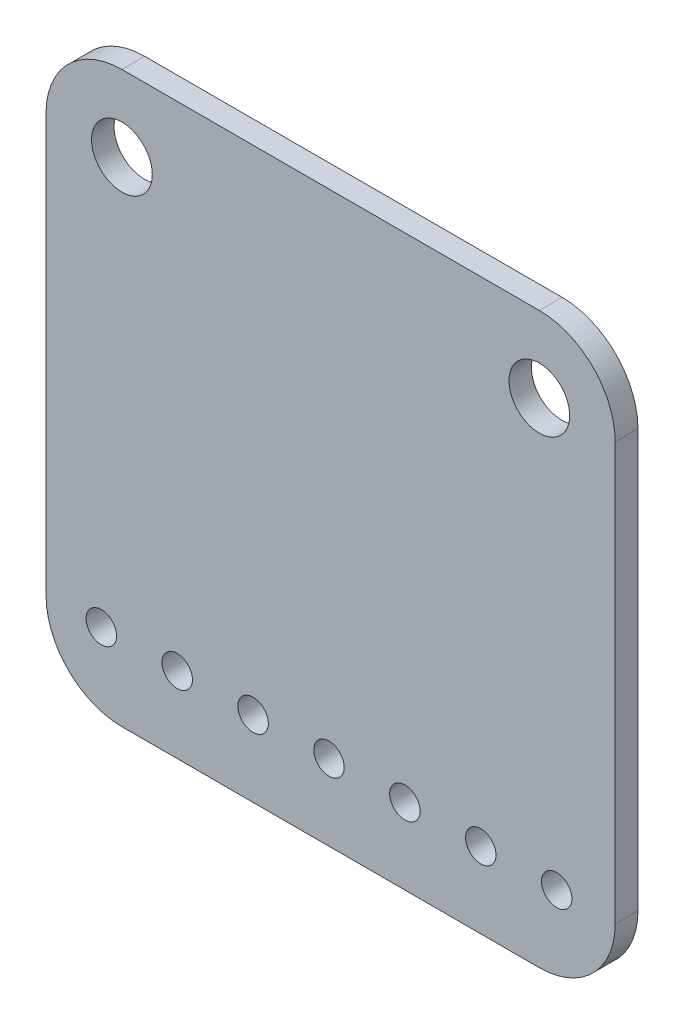
from build123d import *

# Parameters (mm, degrees)
Y_KSEKLIK_EKSTR_ZYON1_DEPTH = 0.762
KES_EKSTR_ZYON1_REACH       = 28.952
IZIM2_R                     = 1.016
KES_EKSTR_ZYON2_REACH       = 28.952
IZIM3_R                     = 0.51
IZIM4_R                     = 1.5
KES_EKSTR_ZYON3_DEPTH       = 0.01
IZIM5_R                     = 1.5
KES_EKSTR_ZYON4_DEPTH       = 0.01
IZIM6_R                     = 0.75
KES_EKSTR_ZYON5_DEPTH       = 0.01
IZIM7_R                     = 0.75
KES_EKSTR_ZYON6_DEPTH       = 0.01
Y_KSEKLIK_EKSTR_ZYON2_DEPTH = 0.1
IZIM9_W                     = 0.047489317
IZIM9_H                     = 0.386698718
Y_KSEKLIK_EKSTR_ZYON4_DEPTH = 0.1
IZIM11_W                    = 5.034397216
IZIM11_H                    = 5.137843734
Y_KSEKLIK_EKSTR_ZYON5_DEPTH = 0.6
IZIM12_W                    = 2.717748304
IZIM12_H                    = 1.321336192
Y_KSEKLIK_EKSTR_ZYON6_DEPTH = 0.4
IZIM13_W                    = 2.687717935
IZIM13_H                    = 1.291305823
IZIM13_W_2                  = 2.70273312
IZIM13_W_3                  = 2.537566095
Y_KSEKLIK_EKSTR_ZYON7_DEPTH = 0.4
IZIM14_W                    = 2.749768636
IZIM14_H                    = 1.266340819
Y_KSEKLIK_EKSTR_ZYON8_DEPTH = 0.4
IZIM15_W                    = 2.012034655
IZIM15_H                    = 2.973006432
Y_KSEKLIK_EKSTR_ZYON9_DEPTH = 0.5


with BuildPart() as part:
    # Çizim1 → Yükseklik-Ekstrüzyon1 (new body)
    with BuildSketch(Plane.XY):
        with BuildLine():
            Line((2.54, 0), (16.51, 0))
            ThreePointArc((16.51, 0), (18.306051224, 0.743948776), (19.05, 2.54))
            Line((19.05, 2.54), (19.05, 16.51))
            ThreePointArc((19.05, 16.51), (18.306051224, 18.306051224), (16.51, 19.05))
            Line((16.51, 19.05), (2.54, 19.05))
            ThreePointArc((2.54, 19.05), (0.743948776, 18.306051224), (0, 16.51))
            Line((0, 16.51), (0, 2.54))
            ThreePointArc((0, 2.54), (0.743948776, 0.743948776), (2.54, 0))
        make_face()
    extrude(amount=Y_KSEKLIK_EKSTR_ZYON1_DEPTH)

    # Çizim2 → Kes-Ekstrüzyon1 (cut, up to next)
    with BuildSketch(Plane.XY.offset(0.762), mode=Mode.PRIVATE) as kes_ekstr_zyon1_sk1:
        with Locations((16.51, 16.51)):
            Circle(IZIM2_R)
    kes_ekstr_zyon1_tool1 = extrude(kes_ekstr_zyon1_sk1.sketch, amount=-KES_EKSTR_ZYON1_REACH, mode=Mode.PRIVATE) & part.part
    # Çizim2 → Kes-Ekstrüzyon1 (cut, up to next)
    with BuildSketch(Plane.XY.offset(0.762), mode=Mode.PRIVATE) as kes_ekstr_zyon1_sk2:
        with Locations((2.54, 16.51)):
            Circle(IZIM2_R)
    kes_ekstr_zyon1_tool2 = extrude(kes_ekstr_zyon1_sk2.sketch, amount=-KES_EKSTR_ZYON1_REACH, mode=Mode.PRIVATE) & part.part
    add(kes_ekstr_zyon1_tool1.solids().sort_by_distance((16.51, 16.51, 0.762))[0], mode=Mode.SUBTRACT)
    add(kes_ekstr_zyon1_tool2.solids().sort_by_distance((2.54, 16.51, 0.762))[0], mode=Mode.SUBTRACT)

    # Çizim3 → Kes-Ekstrüzyon2 (cut, up to next)
    with BuildSketch(Plane.XY.offset(0.762), mode=Mode.PRIVATE) as kes_ekstr_zyon2_sk1:
        with Locations((1.850744747, 2.54)):
            Circle(IZIM3_R)
    kes_ekstr_zyon2_tool1 = extrude(kes_ekstr_zyon2_sk1.sketch, amount=-KES_EKSTR_ZYON2_REACH, mode=Mode.PRIVATE) & part.part
    # Çizim3 → Kes-Ekstrüzyon2 (cut, up to next)
    with BuildSketch(Plane.XY.offset(0.762), mode=Mode.PRIVATE) as kes_ekstr_zyon2_sk2:
        with Locations((4.390744747, 2.54)):
            Circle(IZIM3_R)
    kes_ekstr_zyon2_tool2 = extrude(kes_ekstr_zyon2_sk2.sketch, amount=-KES_EKSTR_ZYON2_REACH, mode=Mode.PRIVATE) & part.part
    # Çizim3 → Kes-Ekstrüzyon2 (cut, up to next)
    with BuildSketch(Plane.XY.offset(0.762), mode=Mode.PRIVATE) as kes_ekstr_zyon2_sk3:
        with Locations((6.930744747, 2.54)):
            Circle(IZIM3_R)
    kes_ekstr_zyon2_tool3 = extrude(kes_ekstr_zyon2_sk3.sketch, amount=-KES_EKSTR_ZYON2_REACH, mode=Mode.PRIVATE) & part.part
    # Çizim3 → Kes-Ekstrüzyon2 (cut, up to next)
    with BuildSketch(Plane.XY.offset(0.762), mode=Mode.PRIVATE) as kes_ekstr_zyon2_sk4:
        with Locations((9.470744747, 2.54)):
            Circle(IZIM3_R)
    kes_ekstr_zyon2_tool4 = extrude(kes_ekstr_zyon2_sk4.sketch, amount=-KES_EKSTR_ZYON2_REACH, mode=Mode.PRIVATE) & part.part
    # Çizim3 → Kes-Ekstrüzyon2 (cut, up to next)
    with BuildSketch(Plane.XY.offset(0.762), mode=Mode.PRIVATE) as kes_ekstr_zyon2_sk5:
        with Locations((12.010744747, 2.54)):
            Circle(IZIM3_R)
    kes_ekstr_zyon2_tool5 = extrude(kes_ekstr_zyon2_sk5.sketch, amount=-KES_EKSTR_ZYON2_REACH, mode=Mode.PRIVATE) & part.part
    # Çizim3 → Kes-Ekstrüzyon2 (cut, up to next)
    with BuildSketch(Plane.XY.offset(0.762), mode=Mode.PRIVATE) as kes_ekstr_zyon2_sk6:
        with Locations((14.550744747, 2.54)):
            Circle(IZIM3_R)
    kes_ekstr_zyon2_tool6 = extrude(kes_ekstr_zyon2_sk6.sketch, amount=-KES_EKSTR_ZYON2_REACH, mode=Mode.PRIVATE) & part.part
    # Çizim3 → Kes-Ekstrüzyon2 (cut, up to next)
    with BuildSketch(Plane.XY.offset(0.762), mode=Mode.PRIVATE) as kes_ekstr_zyon2_sk7:
        with Locations((17.090744747, 2.54)):
            Circle(IZIM3_R)
    kes_ekstr_zyon2_tool7 = extrude(kes_ekstr_zyon2_sk7.sketch, amount=-KES_EKSTR_ZYON2_REACH, mode=Mode.PRIVATE) & part.part
    add(kes_ekstr_zyon2_tool1.solids().sort_by_distance((1.850745, 2.54, 0.762))[0], mode=Mode.SUBTRACT)
    add(kes_ekstr_zyon2_tool2.solids().sort_by_distance((4.390745, 2.54, 0.762))[0], mode=Mode.SUBTRACT)
    add(kes_ekstr_zyon2_tool3.solids().sort_by_distance((6.930745, 2.54, 0.762))[0], mode=Mode.SUBTRACT)
    add(kes_ekstr_zyon2_tool4.solids().sort_by_distance((9.470745, 2.54, 0.762))[0], mode=Mode.SUBTRACT)
    add(kes_ekstr_zyon2_tool5.solids().sort_by_distance((12.010745, 2.54, 0.762))[0], mode=Mode.SUBTRACT)
    add(kes_ekstr_zyon2_tool6.solids().sort_by_distance((14.550745, 2.54, 0.762))[0], mode=Mode.SUBTRACT)
    add(kes_ekstr_zyon2_tool7.solids().sort_by_distance((17.090745, 2.54, 0.762))[0], mode=Mode.SUBTRACT)

    # Çizim4 → Kes-Ekstrüzyon3 (cut)
    with BuildSketch(Plane(origin=(0, 0, 0), x_dir=(-1, 0, 0), z_dir=(0, 0, -1))):
        with Locations((-16.51, 16.51)):
            Circle(IZIM4_R)
    extrude(amount=-KES_EKSTR_ZYON3_DEPTH, mode=Mode.SUBTRACT)

    # Çizim5 → Kes-Ekstrüzyon4 (cut)
    with BuildSketch(Plane(origin=(0, 0, 0), x_dir=(-1, 0, 0), z_dir=(0, 0, -1))):
        with Locations((-2.54, 16.51)):
            Circle(IZIM5_R)
    extrude(amount=-KES_EKSTR_ZYON4_DEPTH, mode=Mode.SUBTRACT)

    # Çizim6 → Kes-Ekstrüzyon5 (cut)
    with BuildSketch(Plane(origin=(0, 0, 0), x_dir=(-1, 0, 0), z_dir=(0, 0, -1))):
        with Locations((-17.090744747, 2.54)):
            Circle(IZIM6_R)
    extrude(amount=-KES_EKSTR_ZYON5_DEPTH, mode=Mode.SUBTRACT)

    # Çizim7 → Kes-Ekstrüzyon6 (cut)
    with BuildSketch(Plane(origin=(0, 0, 0), x_dir=(-1, 0, 0), z_dir=(0, 0, -1))):
        with Locations((-14.550744747, 2.54)):
            Circle(IZIM7_R)
        with Locations((-12.010744747, 2.54)):
            Circle(IZIM7_R)
        with Locations((-9.470744747, 2.54)):
            Circle(IZIM7_R)
        with Locations((-6.930744747, 2.54)):
            Circle(IZIM7_R)
        with Locations((-4.390744747, 2.54)):
            Circle(IZIM7_R)
        with Locations((-1.850744747, 2.54)):
            Circle(IZIM7_R)
    extrude(amount=-KES_EKSTR_ZYON6_DEPTH, mode=Mode.SUBTRACT)

    # Çizim8 → Yükseklik-Ekstrüzyon2 (add)
    # profile 1 of 7: a face of its own
    with BuildSketch(Plane(origin=(0, 0, 0), x_dir=(-1, 0, 0), z_dir=(0, 0, -1))):
        Polygon((-12.627294055, 17.535305759), (-12.016717132, 16.212389093), (-12.145775709, 16.212389093), (-12.341351129, 16.636400845), (-12.941062751, 16.636400845), (-13.142203326, 16.212389093), (-13.271791918, 16.212389093), (-12.644254525, 17.535305759), align=None)
        Polygon((-12.637099326, 17.277453613), (-12.876665966, 16.772084606), (-12.403892863, 16.772084606), align=None, mode=Mode.SUBTRACT)
    # profile 2 of 7: a face of its own
    with BuildSketch(Plane(origin=(0, 0, 0), x_dir=(-1, 0, 0), z_dir=(0, 0, -1))):
        with BuildLine():
            Line((-11.77927055, 16.212389093), (-11.77927055, 17.535305759))
            Line((-11.77927055, 17.535305759), (-11.512143147, 17.535305759))
            add(Edge.make_bspline(
                [(-11.512143147, 17.535305759), (-11.488909333, 17.535138479), (-11.444021725, 17.534815293), (-11.379156306, 17.532766136), (-11.319139824, 17.529141168), (-11.264169666, 17.52386102), (-11.214094922, 17.517377582), (-11.169055805, 17.509250941), (-11.12881943, 17.499654817), (-11.10407354, 17.491473352), (-11.092371512, 17.487604437)],
                knots=[0, 0, 0, 0, 1.314313732, 2.53924729, 3.670748893, 4.714932338, 5.66265055, 6.526160246, 7.303039223, 8, 8, 8, 8], degree=3))
            add(Edge.make_bspline(
                [(-11.092371512, 17.487604437), (-11.077065465, 17.481771998), (-11.04680046, 17.47023938), (-11.003708482, 17.448484468), (-10.963142051, 17.423835468), (-10.924883624, 17.396259889), (-10.889807121, 17.364976936), (-10.856542232, 17.331315478), (-10.826449761, 17.294051433), (-10.798892162, 17.253957613), (-10.774045647, 17.211506331), (-10.752448406, 17.166778478), (-10.734511927, 17.1200012), (-10.719622225, 17.071304581), (-10.707887403, 17.020581546), (-10.699881137, 16.967773031), (-10.694600436, 16.913087742), (-10.694069738, 16.875980132), (-10.693800465, 16.857151963)],
                knots=[0, 0, 0, 0, 0.984719456, 1.947108742, 2.898477687, 3.838006223, 4.779231079, 5.722358779, 6.681677486, 7.655904652, 8.64651281, 9.637519902, 10.640069247, 11.656948941, 12.698408672, 13.768548281, 14.867775369, 16, 16, 16, 16], degree=3))
            add(Edge.make_bspline(
                [(-10.693800465, 16.857151963), (-10.6940382, 16.840800245), (-10.694506681, 16.808577477), (-10.698713297, 16.76108821), (-10.704827561, 16.715007782), (-10.714293671, 16.670555628), (-10.725785098, 16.627342284), (-10.740512619, 16.58582831), (-10.757383774, 16.545632882), (-10.777057389, 16.507299491), (-10.798655472, 16.470982264), (-10.821833631, 16.436746871), (-10.846567144, 16.405081832), (-10.873091862, 16.375891255), (-10.901065017, 16.349219147), (-10.930669749, 16.324842701), (-10.961982449, 16.303238884), (-10.994862871, 16.283558757), (-11.030270218, 16.266390944), (-11.068875144, 16.251865315), (-11.110842285, 16.239828053), (-11.156068632, 16.229784887), (-11.204632327, 16.221818168), (-11.256580984, 16.216478728), (-11.311834787, 16.212867947), (-11.349775759, 16.21255181), (-11.369304188, 16.212389093)],
                knots=[0, 0, 0, 0, 1.105936401, 2.179363191, 3.223086493, 4.248585256, 5.251745608, 6.245858792, 7.225916811, 8.198733463, 9.158002045, 10.082870192, 10.993790845, 11.873723703, 12.748670949, 13.606408763, 14.465103618, 15.319838547, 16.196477973, 17.123216899, 18.106603292, 19.147568657, 20.255746949, 21.433717677, 22.679120308, 24, 24, 24, 24], degree=3))
            Line((-11.369304188, 16.212389093), (-11.77927055, 16.212389093))
        make_face()
        with BuildLine():
            Line((-11.66054726, 16.348072853), (-11.508698051, 16.348072853))
            add(Edge.make_bspline(
                [(-11.508698051, 16.348072853), (-11.486878101, 16.348166628), (-11.444910347, 16.348346991), (-11.384563426, 16.349929654), (-11.329424487, 16.352515743), (-11.279485702, 16.356134895), (-11.234775267, 16.36092333), (-11.195199743, 16.366262207), (-11.160888857, 16.372913624), (-11.140126837, 16.378942707), (-11.13053257, 16.381728786)],
                knots=[0, 0, 0, 0, 1.375205317, 2.645023457, 3.804390687, 4.853969522, 5.800190428, 6.637939096, 7.370582563, 8, 8, 8, 8], degree=3))
            add(Edge.make_bspline(
                [(-11.13053257, 16.381728786), (-11.118456849, 16.385981607), (-11.094593837, 16.394385671), (-11.060242951, 16.409715501), (-11.028206821, 16.42787426), (-10.997927139, 16.448059048), (-10.969833433, 16.470981793), (-10.94359277, 16.496144042), (-10.919257982, 16.523673852), (-10.897080491, 16.553537056), (-10.877233602, 16.585547783), (-10.86004656, 16.61939133), (-10.84498363, 16.65469688), (-10.833161066, 16.692006592), (-10.823894759, 16.73098692), (-10.817331321, 16.771640608), (-10.813243612, 16.813960063), (-10.812766815, 16.842743753), (-10.812523755, 16.857416971)],
                knots=[0, 0, 0, 0, 0.998632004, 1.973411704, 2.929992603, 3.868527914, 4.809262121, 5.754881198, 6.702106254, 7.672490631, 8.653608572, 9.636854334, 10.631411391, 11.644891563, 12.686317036, 13.754757253, 14.855430412, 16, 16, 16, 16], degree=3))
            add(Edge.make_bspline(
                [(-10.812523755, 16.857416971), (-10.812717766, 16.872888852), (-10.813098901, 16.903283499), (-10.817889489, 16.947881172), (-10.824890196, 16.990774156), (-10.835013791, 17.031965319), (-10.847914451, 17.071535024), (-10.864014211, 17.109264422), (-10.882409035, 17.145551977), (-10.904295117, 17.179560145), (-10.928264702, 17.211723314), (-10.954865864, 17.241188416), (-10.98367598, 17.268022571), (-11.014380819, 17.29264368), (-11.047845735, 17.314061201), (-11.083282397, 17.333219559), (-11.121210672, 17.349478542), (-11.147598209, 17.358126207), (-11.161008414, 17.36252097)],
                knots=[0, 0, 0, 0, 1.122418816, 2.205001699, 3.251619955, 4.274784885, 5.280384055, 6.268708349, 7.249350384, 8.229342522, 9.199999885, 10.157847722, 11.105861043, 12.055065948, 13.010012805, 13.98527497, 14.976112212, 16, 16, 16, 16], degree=3))
            add(Edge.make_bspline(
                [(-11.161008414, 17.36252097), (-11.172102449, 17.365588787), (-11.19569141, 17.372111806), (-11.234184303, 17.379227349), (-11.2775061, 17.385503454), (-11.325849142, 17.390817059), (-11.379158321, 17.394629826), (-11.437474638, 17.397491602), (-11.500823298, 17.399421788), (-11.54473753, 17.399553591), (-11.567529682, 17.399621999)],
                knots=[0, 0, 0, 0, 0.674548936, 1.434276114, 2.292660221, 3.240891867, 4.284742987, 5.42552168, 6.663806718, 8, 8, 8, 8], degree=3))
            Line((-11.567529682, 17.399621999), (-11.66054726, 17.399621999))
            Line((-11.66054726, 17.399621999), (-11.66054726, 16.348072853))
        make_face(mode=Mode.SUBTRACT)
    # profile 3 of 7: a face of its own
    with BuildSketch(Plane(origin=(0, 0, 0), x_dir=(-1, 0, 0), z_dir=(0, 0, -1))):
        Polygon((-10.515715529, 17.535305759), (-10.378706732, 17.535305759), (-10.032342132, 16.994160761), (-9.685977532, 17.535305759), (-9.548968734, 17.535305759), (-9.963705229, 16.887097793), (-9.532008264, 16.212389093), (-9.669017061, 16.212389093), (-10.032342132, 16.780034826), (-10.395667202, 16.212389093), (-10.532675999, 16.212389093), (-10.100714027, 16.887097793), align=None)
    # profile 4 of 7: a face of its own
    with BuildSketch(Plane(origin=(0, 0, 0), x_dir=(-1, 0, 0), z_dir=(0, 0, -1))):
        Polygon((-9.303041918, 17.535305759), (-9.184318627, 17.535305759), (-9.184318627, 16.348072853), (-8.675504525, 16.348072853), (-8.675504525, 16.212389093), (-9.303041918, 16.212389093), align=None)
    # profile 5 of 7: a face of its own
    with BuildSketch(Plane(origin=(0, 0, 0), x_dir=(-1, 0, 0), z_dir=(0, 0, -1))):
        with BuildLine():
            Line((-8.404137003, 17.230017298), (-8.522860294, 17.230017298))
            add(Edge.make_bspline(
                [(-8.522860294, 17.230017298), (-8.519643886, 17.243334338), (-8.513356073, 17.269368062), (-8.500241216, 17.306563664), (-8.485953998, 17.341762137), (-8.468797997, 17.374304403), (-8.450084866, 17.404844465), (-8.428645028, 17.43268964), (-8.405467633, 17.458548112), (-8.379831417, 17.48149627), (-8.352946477, 17.502276543), (-8.324433986, 17.519994198), (-8.294867595, 17.535235768), (-8.264042453, 17.547792225), (-8.231866786, 17.557251277), (-8.198631482, 17.564114117), (-8.164249445, 17.568570878), (-8.140910326, 17.569005839), (-8.129059379, 17.5692267)],
                knots=[0, 0, 0, 0, 1.162005537, 2.271625781, 3.343758855, 4.383309926, 5.390229558, 6.379919256, 7.361854164, 8.333198761, 9.295911338, 10.242430842, 11.177959212, 12.116337295, 13.062827104, 14.020064771, 14.994644689, 16, 16, 16, 16], degree=3))
            add(Edge.make_bspline(
                [(-8.129059379, 17.5692267), (-8.11179239, 17.568705383), (-8.077635056, 17.567674122), (-8.027453785, 17.558257059), (-7.979062696, 17.543355297), (-7.932991462, 17.522765525), (-7.89019759, 17.497370321), (-7.85212171, 17.467145554), (-7.819279922, 17.43267439), (-7.791727583, 17.394599879), (-7.770154592, 17.353908659), (-7.754246945, 17.312028838), (-7.74456256, 17.26905976), (-7.743307468, 17.240047336), (-7.74267867, 17.225512173)],
                knots=[0, 0, 0, 0, 1.083050992, 2.142477498, 3.193116406, 4.255571735, 5.30263384, 6.308962982, 7.297363603, 8.282367274, 9.249857812, 10.179914175, 11.08814088, 12, 12, 12, 12], degree=3))
            add(Edge.make_bspline(
                [(-7.74267867, 17.225512173), (-7.74311848, 17.211524486), (-7.743979119, 17.184152752), (-7.751286799, 17.144192544), (-7.763584732, 17.106530391), (-7.780620029, 17.071007749), (-7.802671746, 17.037849849), (-7.829384343, 17.006982086), (-7.860946361, 16.978267553), (-7.884864293, 16.961818229), (-7.897177952, 16.95334963)],
                knots=[0, 0, 0, 0, 1.024540389, 2.004866551, 2.965041327, 3.920577974, 4.882998113, 5.874504559, 6.905732034, 8, 8, 8, 8], degree=3))
            add(Edge.make_bspline(
                [(-7.897177952, 16.95334963), (-7.883105235, 16.946554309), (-7.855223113, 16.933090813), (-7.817217407, 16.906687), (-7.782716544, 16.876200821), (-7.76347615, 16.852409997), (-7.753808979, 16.840456501)],
                knots=[0, 0, 0, 0, 1.015518401, 2.012035669, 3.001164323, 4, 4, 4, 4], degree=3))
            add(Edge.make_bspline(
                [(-7.753808979, 16.840456501), (-7.747443352, 16.831741219), (-7.734816341, 16.814453376), (-7.719230291, 16.786658358), (-7.705090536, 16.758555265), (-7.694072447, 16.729390847), (-7.685540063, 16.69950313), (-7.679441027, 16.668840796), (-7.675652141, 16.637378806), (-7.675109536, 16.616094029), (-7.67483679, 16.605394986)],
                knots=[0, 0, 0, 0, 1.025084078, 2.033381695, 3.024893161, 4.013698104, 4.991890475, 5.976764909, 6.982997093, 8, 8, 8, 8], degree=3))
            add(Edge.make_bspline(
                [(-7.67483679, 16.605394986), (-7.675515073, 16.586870478), (-7.676868448, 16.549908639), (-7.688965226, 16.495300634), (-7.70771785, 16.441920757), (-7.734348894, 16.390865684), (-7.766804768, 16.343096909), (-7.805417804, 16.300356756), (-7.849749274, 16.263617998), (-7.899190695, 16.232922465), (-7.952756395, 16.208385036), (-8.01004836, 16.191354396), (-8.070241089, 16.180262307), (-8.111518847, 16.179072865), (-8.132504475, 16.178468153)],
                knots=[0, 0, 0, 0, 0.955779014, 1.907060117, 2.875433937, 3.871313158, 4.872415639, 5.851225146, 6.836215519, 7.83643374, 8.849228613, 9.86973379, 10.916971861, 12, 12, 12, 12], degree=3))
            add(Edge.make_bspline(
                [(-8.132504475, 16.178468153), (-8.146648079, 16.178796317), (-8.174477977, 16.179442034), (-8.215391442, 16.183856267), (-8.254444584, 16.191918501), (-8.291690206, 16.202767667), (-8.327161395, 16.216522879), (-8.360749911, 16.233652268), (-8.392662401, 16.253802746), (-8.422597719, 16.277212168), (-8.450552296, 16.303398865), (-8.475783237, 16.332827717), (-8.498711194, 16.364954712), (-8.518722251, 16.40015301), (-8.536727885, 16.437967735), (-8.551537354, 16.47888309), (-8.564572078, 16.522533301), (-8.570632345, 16.55295197), (-8.573741704, 16.568558965)],
                knots=[0, 0, 0, 0, 1.048658725, 2.063410685, 3.046034179, 4.001477787, 4.936774919, 5.862367409, 6.792675028, 7.730719943, 8.675894397, 9.627829632, 10.600096036, 11.597688215, 12.626045268, 13.701542398, 14.82072376, 16, 16, 16, 16], degree=3))
            Line((-8.573741704, 16.568558965), (-8.455018414, 16.568558965))
            add(Edge.make_bspline(
                [(-8.455018414, 16.568558965), (-8.451925324, 16.558372879), (-8.445908997, 16.538560058), (-8.435667997, 16.510045419), (-8.424000525, 16.483905322), (-8.411484011, 16.459948011), (-8.398338586, 16.437937549), (-8.383629671, 16.41845595), (-8.368446691, 16.400647525), (-8.357001816, 16.390614294), (-8.351400542, 16.385703896)],
                knots=[0, 0, 0, 0, 1.198163088, 2.33053128, 3.407730985, 4.417276592, 5.372219308, 6.28897303, 7.162600585, 8, 8, 8, 8], degree=3))
            add(Edge.make_bspline(
                [(-8.351400542, 16.385703896), (-8.343993502, 16.379993306), (-8.329202287, 16.368589752), (-8.305099414, 16.354037053), (-8.279750484, 16.34142738), (-8.252606247, 16.33179515), (-8.22425245, 16.323639308), (-8.194230797, 16.318302088), (-8.162806153, 16.31464019), (-8.14134929, 16.314317046), (-8.130384416, 16.314151913)],
                knots=[0, 0, 0, 0, 0.946170439, 1.889420265, 2.845303464, 3.807233317, 4.801018734, 5.828864929, 6.890507805, 8, 8, 8, 8], degree=3))
            add(Edge.make_bspline(
                [(-8.130384416, 16.314151913), (-8.118004372, 16.314384711), (-8.093796264, 16.314839926), (-8.058472552, 16.31902628), (-8.024867654, 16.325123192), (-7.993354673, 16.334539706), (-7.963520821, 16.346174135), (-7.935784304, 16.360782312), (-7.909781014, 16.377921537), (-7.885844007, 16.397402112), (-7.864319961, 16.418728094), (-7.845368419, 16.44103363), (-7.829257311, 16.464224673), (-7.816261138, 16.488429558), (-7.805998876, 16.513548052), (-7.799012666, 16.539650645), (-7.794155099, 16.566523719), (-7.793759505, 16.584790918), (-7.79356008, 16.59399967)],
                knots=[0, 0, 0, 0, 1.217147791, 2.380027433, 3.494444702, 4.572153297, 5.609568379, 6.639424714, 7.649109417, 8.668170816, 9.669597737, 10.625200337, 11.543417969, 12.441394052, 13.322311151, 14.205496177, 15.095365482, 16, 16, 16, 16], degree=3))
            add(Edge.make_bspline(
                [(-7.79356008, 16.59399967), (-7.794138498, 16.606325979), (-7.795292455, 16.630917265), (-7.804102543, 16.667096229), (-7.818593721, 16.701954483), (-7.838880652, 16.734897296), (-7.863576002, 16.765428664), (-7.892440118, 16.792669968), (-7.925712693, 16.815148247), (-7.956336274, 16.83067878), (-7.983461795, 16.841276127), (-8.006675348, 16.848334819), (-8.032663707, 16.854312005), (-8.061112595, 16.859872893), (-8.09223637, 16.864605664), (-8.126001149, 16.868552422), (-8.162413773, 16.871710429), (-8.187621446, 16.873120694), (-8.200611362, 16.873847426)],
                knots=[0, 0, 0, 0, 1.07054697, 2.135767047, 3.216561865, 4.33974944, 5.486079747, 6.621378074, 7.775625952, 8.963672916, 9.598146892, 10.304877434, 11.070270905, 11.915000392, 12.823868403, 13.805723172, 14.86925407, 16, 16, 16, 16], degree=3))
            Line((-8.200611362, 16.873847426), (-8.200611362, 17.009531187))
            add(Edge.make_bspline(
                [(-8.200611362, 17.009531187), (-8.184244553, 17.009808925), (-8.152185993, 17.010352946), (-8.105356896, 17.01693276), (-8.060576805, 17.026034664), (-8.018838125, 17.039976388), (-7.980795308, 17.056169), (-7.947790578, 17.075011949), (-7.920286328, 17.095957404), (-7.898416221, 17.119328659), (-7.881963209, 17.144394168), (-7.869933437, 17.170518619), (-7.862827362, 17.197930987), (-7.861878767, 17.216638793), (-7.861401961, 17.226042188)],
                knots=[0, 0, 0, 0, 1.321986639, 2.589447074, 3.816329219, 5.01088745, 6.139805852, 7.153945165, 8.075214402, 8.924034688, 9.728124013, 10.488707548, 11.240355623, 12, 12, 12, 12], degree=3))
            add(Edge.make_bspline(
                [(-7.861401961, 17.226042188), (-7.861558598, 17.23295074), (-7.861870221, 17.246694978), (-7.865800144, 17.266774989), (-7.87170566, 17.28624112), (-7.879824486, 17.30501059), (-7.890691377, 17.322953223), (-7.90369602, 17.340221991), (-7.919180987, 17.356718301), (-7.936925248, 17.372094493), (-7.95597971, 17.386748341), (-7.97686281, 17.399188912), (-7.998944887, 17.409827076), (-8.022250391, 17.418599715), (-8.046854951, 17.42519891), (-8.072642966, 17.42993716), (-8.099663608, 17.432899607), (-8.118098161, 17.433326121), (-8.127469335, 17.433542939)],
                knots=[0, 0, 0, 0, 0.884392785, 1.759457502, 2.611959086, 3.489218968, 4.37281399, 5.2945488, 6.255912374, 7.266815255, 8.301784654, 9.332968512, 10.37626691, 11.440494194, 12.520033166, 13.637162961, 14.798855837, 16, 16, 16, 16], degree=3))
            add(Edge.make_bspline(
                [(-8.127469335, 17.433542939), (-8.142532317, 17.433017037), (-8.171953823, 17.431989829), (-8.21436839, 17.422992857), (-8.253798615, 17.408638045), (-8.283937932, 17.391503243), (-8.306194143, 17.374588645), (-8.322098224, 17.359816433), (-8.337716393, 17.34339986), (-8.352021158, 17.324327795), (-8.36648781, 17.303891836), (-8.379658224, 17.281053123), (-8.392456382, 17.256407415), (-8.40016806, 17.238984362), (-8.404137003, 17.230017298)],
                knots=[0, 0, 0, 0, 1.472543308, 2.876219568, 4.221790263, 5.565193594, 6.249813518, 6.953379497, 7.687249741, 8.463570142, 9.283606569, 10.136032583, 11.040678096, 12, 12, 12, 12], degree=3))
        make_face()
    # profile 6 of 7: a face of its own
    with BuildSketch(Plane(origin=(0, 0, 0), x_dir=(-1, 0, 0), z_dir=(0, 0, -1))):
        with BuildLine():
            Line((-7.386508798, 17.230017298), (-7.505232089, 17.230017298))
            add(Edge.make_bspline(
                [(-7.505232089, 17.230017298), (-7.502015681, 17.243334338), (-7.495727868, 17.269368062), (-7.482613011, 17.306563664), (-7.468325792, 17.341762137), (-7.451169792, 17.374304403), (-7.432456661, 17.404844465), (-7.411016823, 17.43268964), (-7.387839428, 17.458548112), (-7.362203212, 17.48149627), (-7.335318271, 17.502276543), (-7.306805781, 17.519994198), (-7.27723939, 17.535235768), (-7.246414247, 17.547792225), (-7.214238581, 17.557251277), (-7.181003277, 17.564114117), (-7.14662124, 17.568570878), (-7.123282121, 17.569005839), (-7.111431174, 17.5692267)],
                knots=[0, 0, 0, 0, 1.162005537, 2.271625781, 3.343758855, 4.383309926, 5.390229558, 6.379919256, 7.361854164, 8.333198761, 9.295911338, 10.242430842, 11.177959212, 12.116337295, 13.062827104, 14.020064771, 14.994644689, 16, 16, 16, 16], degree=3))
            add(Edge.make_bspline(
                [(-7.111431174, 17.5692267), (-7.094164185, 17.568705383), (-7.060006851, 17.567674122), (-7.00982558, 17.558257059), (-6.961434491, 17.543355297), (-6.915363257, 17.522765525), (-6.872569385, 17.497370321), (-6.834493505, 17.467145554), (-6.801651717, 17.43267439), (-6.774099378, 17.394599879), (-6.752526387, 17.353908659), (-6.73661874, 17.312028838), (-6.726934354, 17.26905976), (-6.725679263, 17.240047336), (-6.725050465, 17.225512173)],
                knots=[0, 0, 0, 0, 1.083050992, 2.142477498, 3.193116406, 4.255571735, 5.30263384, 6.308962982, 7.297363603, 8.282367274, 9.249857812, 10.179914175, 11.08814088, 12, 12, 12, 12], degree=3))
            add(Edge.make_bspline(
                [(-6.725050465, 17.225512173), (-6.725490275, 17.211524486), (-6.726350914, 17.184152752), (-6.733658594, 17.144192544), (-6.745956527, 17.106530391), (-6.762991824, 17.071007749), (-6.785043541, 17.037849849), (-6.811756138, 17.006982086), (-6.843318156, 16.978267553), (-6.867236088, 16.961818229), (-6.879549747, 16.95334963)],
                knots=[0, 0, 0, 0, 1.024540389, 2.004866551, 2.965041327, 3.920577974, 4.882998113, 5.874504559, 6.905732034, 8, 8, 8, 8], degree=3))
            add(Edge.make_bspline(
                [(-6.879549747, 16.95334963), (-6.86547703, 16.946554309), (-6.837594908, 16.933090813), (-6.799589202, 16.906687), (-6.765088338, 16.876200821), (-6.745847945, 16.852409997), (-6.736180773, 16.840456501)],
                knots=[0, 0, 0, 0, 1.015518401, 2.012035669, 3.001164323, 4, 4, 4, 4], degree=3))
            add(Edge.make_bspline(
                [(-6.736180773, 16.840456501), (-6.729815147, 16.831741219), (-6.717188136, 16.814453376), (-6.701602086, 16.786658358), (-6.687462331, 16.758555265), (-6.676444242, 16.729390847), (-6.667911858, 16.69950313), (-6.661812822, 16.668840796), (-6.658023936, 16.637378806), (-6.657481331, 16.616094029), (-6.657208585, 16.605394986)],
                knots=[0, 0, 0, 0, 1.025084078, 2.033381695, 3.024893161, 4.013698104, 4.991890475, 5.976764909, 6.982997093, 8, 8, 8, 8], degree=3))
            add(Edge.make_bspline(
                [(-6.657208585, 16.605394986), (-6.657886868, 16.586870478), (-6.659240243, 16.549908639), (-6.671337021, 16.495300634), (-6.690089644, 16.441920757), (-6.716720689, 16.390865684), (-6.749176563, 16.343096909), (-6.787789599, 16.300356756), (-6.832121069, 16.263617998), (-6.88156249, 16.232922465), (-6.93512819, 16.208385036), (-6.992420155, 16.191354396), (-7.052612883, 16.180262307), (-7.093890642, 16.179072865), (-7.11487627, 16.178468153)],
                knots=[0, 0, 0, 0, 0.955779014, 1.907060117, 2.875433937, 3.871313158, 4.872415639, 5.851225146, 6.836215519, 7.83643374, 8.849228613, 9.86973379, 10.916971861, 12, 12, 12, 12], degree=3))
            add(Edge.make_bspline(
                [(-7.11487627, 16.178468153), (-7.129019874, 16.178796317), (-7.156849772, 16.179442034), (-7.197763237, 16.183856267), (-7.236816379, 16.191918501), (-7.274062001, 16.202767667), (-7.30953319, 16.216522879), (-7.343121706, 16.233652268), (-7.375034196, 16.253802746), (-7.404969513, 16.277212168), (-7.432924091, 16.303398865), (-7.458155032, 16.332827717), (-7.481082989, 16.364954712), (-7.501094046, 16.40015301), (-7.51909968, 16.437967735), (-7.533909149, 16.47888309), (-7.546943872, 16.522533301), (-7.55300414, 16.55295197), (-7.556113499, 16.568558965)],
                knots=[0, 0, 0, 0, 1.048658725, 2.063410685, 3.046034179, 4.001477787, 4.936774919, 5.862367409, 6.792675028, 7.730719943, 8.675894397, 9.627829632, 10.600096036, 11.597688215, 12.626045268, 13.701542398, 14.82072376, 16, 16, 16, 16], degree=3))
            Line((-7.556113499, 16.568558965), (-7.437390208, 16.568558965))
            add(Edge.make_bspline(
                [(-7.437390208, 16.568558965), (-7.434297119, 16.558372879), (-7.428280792, 16.538560058), (-7.418039792, 16.510045419), (-7.40637232, 16.483905322), (-7.393855806, 16.459948011), (-7.380710381, 16.437937549), (-7.366001466, 16.41845595), (-7.350818485, 16.400647525), (-7.339373611, 16.390614294), (-7.333772337, 16.385703896)],
                knots=[0, 0, 0, 0, 1.198163088, 2.33053128, 3.407730985, 4.417276592, 5.372219308, 6.28897303, 7.162600585, 8, 8, 8, 8], degree=3))
            add(Edge.make_bspline(
                [(-7.333772337, 16.385703896), (-7.326365297, 16.379993306), (-7.311574082, 16.368589752), (-7.287471209, 16.354037053), (-7.262122279, 16.34142738), (-7.234978042, 16.33179515), (-7.206624245, 16.323639308), (-7.176602592, 16.318302088), (-7.145177948, 16.31464019), (-7.123721085, 16.314317046), (-7.112756211, 16.314151913)],
                knots=[0, 0, 0, 0, 0.946170439, 1.889420265, 2.845303464, 3.807233317, 4.801018734, 5.828864929, 6.890507805, 8, 8, 8, 8], degree=3))
            add(Edge.make_bspline(
                [(-7.112756211, 16.314151913), (-7.100376167, 16.314384711), (-7.076168059, 16.314839926), (-7.040844347, 16.31902628), (-7.007239449, 16.325123192), (-6.975726468, 16.334539706), (-6.945892616, 16.346174135), (-6.918156099, 16.360782312), (-6.892152809, 16.377921537), (-6.868215802, 16.397402112), (-6.846691756, 16.418728094), (-6.827740213, 16.44103363), (-6.811629106, 16.464224673), (-6.798632932, 16.488429558), (-6.788370671, 16.513548052), (-6.781384461, 16.539650645), (-6.776526894, 16.566523719), (-6.7761313, 16.584790918), (-6.775931875, 16.59399967)],
                knots=[0, 0, 0, 0, 1.217147791, 2.380027433, 3.494444702, 4.572153297, 5.609568379, 6.639424714, 7.649109417, 8.668170816, 9.669597737, 10.625200337, 11.543417969, 12.441394052, 13.322311151, 14.205496177, 15.095365482, 16, 16, 16, 16], degree=3))
            add(Edge.make_bspline(
                [(-6.775931875, 16.59399967), (-6.776510293, 16.606325979), (-6.77766425, 16.630917265), (-6.786474338, 16.667096229), (-6.800965516, 16.701954483), (-6.821252447, 16.734897296), (-6.845947797, 16.765428664), (-6.874811913, 16.792669968), (-6.908084488, 16.815148247), (-6.938708069, 16.83067878), (-6.96583359, 16.841276127), (-6.989047143, 16.848334819), (-7.015035502, 16.854312005), (-7.04348439, 16.859872893), (-7.074608165, 16.864605664), (-7.108372943, 16.868552422), (-7.144785568, 16.871710429), (-7.16999324, 16.873120694), (-7.182983157, 16.873847426)],
                knots=[0, 0, 0, 0, 1.07054697, 2.135767047, 3.216561865, 4.33974944, 5.486079747, 6.621378074, 7.775625952, 8.963672916, 9.598146892, 10.304877434, 11.070270905, 11.915000392, 12.823868403, 13.805723172, 14.86925407, 16, 16, 16, 16], degree=3))
            Line((-7.182983157, 16.873847426), (-7.182983157, 17.009531187))
            add(Edge.make_bspline(
                [(-7.182983157, 17.009531187), (-7.166616348, 17.009808925), (-7.134557788, 17.010352946), (-7.087728691, 17.01693276), (-7.042948599, 17.026034664), (-7.00120992, 17.039976388), (-6.963167103, 17.056169), (-6.930162372, 17.075011949), (-6.902658123, 17.095957404), (-6.880788016, 17.119328659), (-6.864335004, 17.144394168), (-6.852305232, 17.170518619), (-6.845199157, 17.197930987), (-6.844250562, 17.216638793), (-6.843773755, 17.226042188)],
                knots=[0, 0, 0, 0, 1.321986639, 2.589447074, 3.816329219, 5.01088745, 6.139805852, 7.153945165, 8.075214402, 8.924034688, 9.728124013, 10.488707548, 11.240355623, 12, 12, 12, 12], degree=3))
            add(Edge.make_bspline(
                [(-6.843773755, 17.226042188), (-6.843930393, 17.23295074), (-6.844242016, 17.246694978), (-6.848171939, 17.266774989), (-6.854077455, 17.28624112), (-6.862196281, 17.30501059), (-6.873063172, 17.322953223), (-6.886067815, 17.340221991), (-6.901552782, 17.356718301), (-6.919297043, 17.372094493), (-6.938351505, 17.386748341), (-6.959234604, 17.399188912), (-6.981316682, 17.409827076), (-7.004622186, 17.418599715), (-7.029226746, 17.42519891), (-7.055014761, 17.42993716), (-7.082035403, 17.432899607), (-7.100469956, 17.433326121), (-7.10984113, 17.433542939)],
                knots=[0, 0, 0, 0, 0.884392785, 1.759457502, 2.611959086, 3.489218968, 4.37281399, 5.2945488, 6.255912374, 7.266815255, 8.301784654, 9.332968512, 10.37626691, 11.440494194, 12.520033166, 13.637162961, 14.798855837, 16, 16, 16, 16], degree=3))
            add(Edge.make_bspline(
                [(-7.10984113, 17.433542939), (-7.124904112, 17.433017037), (-7.154325618, 17.431989829), (-7.196740185, 17.422992857), (-7.236170409, 17.408638045), (-7.266309727, 17.391503243), (-7.288565938, 17.374588645), (-7.304470019, 17.359816433), (-7.320088188, 17.34339986), (-7.334392953, 17.324327795), (-7.348859605, 17.303891836), (-7.362030019, 17.281053123), (-7.374828177, 17.256407415), (-7.382539855, 17.238984362), (-7.386508798, 17.230017298)],
                knots=[0, 0, 0, 0, 1.472543308, 2.876219568, 4.221790263, 5.565193594, 6.249813518, 6.953379497, 7.687249741, 8.463570142, 9.283606569, 10.136032583, 11.040678096, 12, 12, 12, 12], degree=3))
        make_face()
    # profile 7 of 7: a face of its own
    with BuildSketch(Plane(origin=(0, 0, 0), x_dir=(-1, 0, 0), z_dir=(0, 0, -1))):
        with BuildLine():
            Line((-5.70742226, 17.535305759), (-5.70742226, 17.399621999))
            Line((-5.70742226, 17.399621999), (-6.157404732, 17.399621999))
            Line((-6.157404732, 17.399621999), (-6.228691708, 17.051667355))
            add(Edge.make_bspline(
                [(-6.228691708, 17.051667355), (-6.214685469, 17.055534154), (-6.187550598, 17.063025466), (-6.147500293, 17.071343123), (-6.109478836, 17.076357145), (-6.0848063, 17.077041777), (-6.072867389, 17.077373067)],
                knots=[0, 0, 0, 0, 1.100273476, 2.13160584, 3.095893838, 4, 4, 4, 4], degree=3))
            add(Edge.make_bspline(
                [(-6.072867389, 17.077373067), (-6.058094666, 17.077053324), (-6.029047801, 17.076424628), (-5.986548556, 17.070387649), (-5.945979278, 17.06088536), (-5.907424811, 17.047610639), (-5.870813829, 17.030635829), (-5.836483173, 17.009431387), (-5.803917534, 16.984661348), (-5.773701136, 16.956182728), (-5.746288675, 16.924840331), (-5.722186649, 16.891140779), (-5.701714479, 16.855411573), (-5.685249551, 16.817311343), (-5.672101901, 16.777261306), (-5.663350998, 16.734840062), (-5.657523849, 16.690447469), (-5.656872828, 16.660094253), (-5.65654085, 16.644616073)],
                knots=[0, 0, 0, 0, 1.052922333, 2.070308379, 3.05430497, 4.020497103, 4.973039431, 5.925935799, 6.892292201, 7.88610001, 8.88166317, 9.857072816, 10.836096531, 11.812156883, 12.81219415, 13.836441305, 14.89672472, 16, 16, 16, 16], degree=3))
            add(Edge.make_bspline(
                [(-5.65654085, 16.644616073), (-5.656792232, 16.633835352), (-5.6572916, 16.612419604), (-5.659831066, 16.5806151), (-5.664720459, 16.54948391), (-5.671285045, 16.519021905), (-5.679805542, 16.489286755), (-5.690120155, 16.46019335), (-5.702743058, 16.43192277), (-5.716588846, 16.404207516), (-5.732179033, 16.377674152), (-5.749482218, 16.352860398), (-5.767763223, 16.329394018), (-5.787433627, 16.307526684), (-5.808676265, 16.287402091), (-5.831233872, 16.268900806), (-5.854926447, 16.251709946), (-5.880120542, 16.236527325), (-5.906254754, 16.222556207), (-5.933706491, 16.211094632), (-5.961850863, 16.200847498), (-5.991092944, 16.192679611), (-6.021366498, 16.186279509), (-6.052721428, 16.181932555), (-6.084993288, 16.178766462), (-6.106868665, 16.178568267), (-6.117918637, 16.178468153)],
                knots=[0, 0, 0, 0, 1.056347294, 2.098418968, 3.122841568, 4.141288669, 5.149314143, 6.15115421, 7.162517403, 8.180376062, 9.185164535, 10.17417709, 11.141909838, 12.097768115, 13.052685741, 14.0056014, 14.954263652, 15.917497458, 16.885230207, 17.854509472, 18.828990115, 19.81800267, 20.826176721, 21.857883937, 22.917946725, 24, 24, 24, 24], degree=3))
            add(Edge.make_bspline(
                [(-6.117918637, 16.178468153), (-6.131100247, 16.178729273), (-6.157033508, 16.179242996), (-6.195027889, 16.184617245), (-6.231583707, 16.192314321), (-6.266406692, 16.203894101), (-6.299808925, 16.218403585), (-6.331340726, 16.236741542), (-6.36180779, 16.257522335), (-6.389971566, 16.282045563), (-6.416110931, 16.308850003), (-6.439510117, 16.337938159), (-6.460349296, 16.368829942), (-6.478294754, 16.401675375), (-6.493602042, 16.436388153), (-6.50562735, 16.473098335), (-6.515333157, 16.51161411), (-6.519439271, 16.538130467), (-6.521524824, 16.551598494)],
                knots=[0, 0, 0, 0, 1.0467383, 2.05933395, 3.04377827, 4.011590433, 4.970194871, 5.932262533, 6.905835911, 7.896367577, 8.894135286, 9.877477877, 10.858688626, 11.851381753, 12.8477658, 13.868841284, 14.917554742, 16, 16, 16, 16], degree=3))
            Line((-6.521524824, 16.551598494), (-6.402801533, 16.551598494))
            add(Edge.make_bspline(
                [(-6.402801533, 16.551598494), (-6.399880323, 16.53898299), (-6.394265593, 16.51473529), (-6.381941397, 16.480667789), (-6.366873045, 16.450309035), (-6.34895533, 16.423257437), (-6.327580765, 16.399668322), (-6.303190177, 16.378646396), (-6.27584446, 16.359681392), (-6.245457734, 16.343873382), (-6.213400409, 16.330391442), (-6.179848517, 16.321413867), (-6.145715624, 16.315101327), (-6.122629455, 16.314469442), (-6.111028446, 16.314151913)],
                knots=[0, 0, 0, 0, 1.136247022, 2.183929868, 3.172523383, 4.106158343, 5.02341133, 5.958108904, 6.928429099, 7.938127109, 8.96079061, 9.975095812, 10.982467395, 12, 12, 12, 12], degree=3))
            add(Edge.make_bspline(
                [(-6.111028446, 16.314151913), (-6.099704868, 16.314462148), (-6.077408649, 16.315073002), (-6.044596011, 16.319774652), (-6.01291674, 16.327015758), (-5.982683424, 16.337852281), (-5.953367009, 16.351022755), (-5.925709066, 16.367923989), (-5.898909466, 16.387374651), (-5.873801214, 16.409658853), (-5.85080535, 16.434215851), (-5.830486816, 16.460476651), (-5.813562209, 16.488491054), (-5.799299614, 16.517774062), (-5.78846935, 16.548646611), (-5.780743146, 16.58096402), (-5.776206275, 16.614806111), (-5.775582168, 16.637888856), (-5.77526414, 16.649651212)],
                knots=[0, 0, 0, 0, 1.027316725, 2.022795036, 3.002884548, 3.971462791, 4.93288096, 5.914575861, 6.907176829, 7.935150275, 8.956128384, 9.956726525, 10.942570165, 11.921478529, 12.907843606, 13.90538589, 14.932640048, 16, 16, 16, 16], degree=3))
            add(Edge.make_bspline(
                [(-5.77526414, 16.649651212), (-5.77551303, 16.660263178), (-5.776000196, 16.681034591), (-5.7799805, 16.711423576), (-5.78690388, 16.740177375), (-5.796513501, 16.767434839), (-5.808714386, 16.793221675), (-5.823624153, 16.817564499), (-5.84152261, 16.840142465), (-5.861968056, 16.860966139), (-5.884366185, 16.880184291), (-5.909102361, 16.896567324), (-5.935658941, 16.910349816), (-5.963715962, 16.922243971), (-5.99394079, 16.930786514), (-6.025734874, 16.937199971), (-6.059441546, 16.940909944), (-6.082487015, 16.941424706), (-6.094332984, 16.941689306)],
                knots=[0, 0, 0, 0, 1.045622112, 2.046656509, 3.013763289, 3.955457236, 4.890082067, 5.820317437, 6.762574623, 7.722996705, 8.69280354, 9.665887285, 10.63943826, 11.638615906, 12.663482002, 13.728887084, 14.832589034, 16, 16, 16, 16], degree=3))
            add(Edge.make_bspline(
                [(-6.094332984, 16.941689306), (-6.104587073, 16.941469857), (-6.125759165, 16.941016749), (-6.158235948, 16.937680543), (-6.19236407, 16.932298429), (-6.228012703, 16.924895294), (-6.265288907, 16.915207357), (-6.304114017, 16.903598007), (-6.344569665, 16.889717966), (-6.371828448, 16.879235849), (-6.385841063, 16.873847426)],
                knots=[0, 0, 0, 0, 0.817624296, 1.688186739, 2.600797293, 3.572016777, 4.590301741, 5.671205678, 6.80286297, 8, 8, 8, 8], degree=3))
            Line((-6.385841063, 16.873847426), (-6.250157302, 17.535305759))
            Line((-6.250157302, 17.535305759), (-5.70742226, 17.535305759))
        make_face()
    extrude(amount=Y_KSEKLIK_EKSTR_ZYON2_DEPTH)

    # Çizim9 → Yükseklik-Ekstrüzyon4 (add)
    # profile 1 of 26: a face of its own
    with BuildSketch(Plane(origin=(0, 0, 0), x_dir=(-1, 0, 0), z_dir=(0, 0, -1))):
        Polygon((-17.979141462, 4.301826386), (-17.928260052, 4.301826386), (-17.751871163, 3.884810828), (-17.575482274, 4.301826386), (-17.524600864, 4.301826386), (-17.748479069, 3.772659719), (-17.755263257, 3.772659719), align=None)
    # profile 2 of 26: a face of its own
    with BuildSketch(Plane(origin=(0, 0, 0), x_dir=(-1, 0, 0), z_dir=(0, 0, -1))):
        with BuildLine():
            add(Edge.make_bspline(
                [(-17.426442143, 4.32217895), (-17.423495242, 4.322042251), (-17.417724643, 4.321774568), (-17.409379947, 4.319482297), (-17.401781565, 4.315596749), (-17.395041837, 4.31038375), (-17.389258516, 4.30425306), (-17.385209527, 4.297107652), (-17.382607177, 4.289388072), (-17.382292919, 4.284003409), (-17.382132915, 4.281261816)],
                knots=[0, 0, 0, 0, 1.055194115, 2.066272739, 3.074728998, 4.095836921, 5.109056067, 6.073838105, 7.019297344, 8, 8, 8, 8], degree=3))
            add(Edge.make_bspline(
                [(-17.382132915, 4.281261816), (-17.382296528, 4.278591391), (-17.38261997, 4.273312277), (-17.385207517, 4.265726526), (-17.389293022, 4.258680402), (-17.395038128, 4.252561616), (-17.401782548, 4.247351499), (-17.409379686, 4.243465187), (-17.417724712, 4.241173119), (-17.423495265, 4.240905407), (-17.426442143, 4.240768694)],
                knots=[0, 0, 0, 0, 0.96129708, 1.900370562, 2.859976407, 3.87933698, 4.906634145, 5.921202961, 6.938410037, 8, 8, 8, 8], degree=3))
            add(Edge.make_bspline(
                [(-17.426442143, 4.240768694), (-17.429355323, 4.240900187), (-17.435025447, 4.241156122), (-17.443245196, 4.24351016), (-17.450778789, 4.247352829), (-17.457531662, 4.252527502), (-17.463160512, 4.25871798), (-17.467257521, 4.265722226), (-17.469839093, 4.273313372), (-17.47016334, 4.278591759), (-17.47032736, 4.281261816)],
                knots=[0, 0, 0, 0, 1.054934014, 2.053291228, 3.073705704, 4.106921865, 5.123545215, 6.088680038, 7.033164197, 8, 8, 8, 8], degree=3))
            add(Edge.make_bspline(
                [(-17.47032736, 4.281261816), (-17.470166934, 4.284003028), (-17.469851846, 4.289386941), (-17.467255586, 4.297112023), (-17.463194639, 4.304215179), (-17.457527935, 4.310417844), (-17.450779781, 4.315595427), (-17.443244939, 4.319437326), (-17.435025515, 4.321791564), (-17.429355346, 4.322047471), (-17.426442143, 4.32217895)],
                knots=[0, 0, 0, 0, 0.98631895, 1.937192651, 2.907499808, 3.917963147, 4.944918757, 5.95915025, 6.951458133, 8, 8, 8, 8], degree=3))
        make_face()
    # profile 3 of 26: a face of its own
    with BuildSketch(Plane(origin=(0, 0, 0), x_dir=(-1, 0, 0), z_dir=(0, 0, -1))):
        with Locations((-17.426230137, 3.966009078)):
            Rectangle(IZIM9_W, IZIM9_H)
    # profile 4 of 26: a face of its own
    with BuildSketch(Plane(origin=(0, 0, 0), x_dir=(-1, 0, 0), z_dir=(0, 0, -1))):
        with BuildLine():
            Line((-17.287154283, 4.159358437), (-17.239664967, 4.159358437))
            Line((-17.239664967, 4.159358437), (-17.239664967, 4.089608504))
            add(Edge.make_bspline(
                [(-17.239664967, 4.089608504), (-17.234594396, 4.095934725), (-17.224754776, 4.108210978), (-17.208368097, 4.124346113), (-17.19105015, 4.137642593), (-17.17290699, 4.148241619), (-17.153913987, 4.156231526), (-17.134186915, 4.162001851), (-17.113607668, 4.165461819), (-17.099612807, 4.165913914), (-17.092532889, 4.166142625)],
                knots=[0, 0, 0, 0, 1.12780773, 2.188550248, 3.19190651, 4.159438251, 5.104880172, 6.052711206, 7.014878035, 8, 8, 8, 8], degree=3))
            add(Edge.make_bspline(
                [(-17.092532889, 4.166142625), (-17.085376948, 4.165878769), (-17.071371045, 4.165362337), (-17.050978766, 4.16127767), (-17.031932789, 4.154300947), (-17.014301023, 4.144743884), (-16.998406789, 4.132859334), (-16.984448151, 4.119013646), (-16.972902755, 4.103087833), (-16.965162202, 4.088313023), (-16.960063205, 4.075206503), (-16.956853078, 4.063981101), (-16.954126965, 4.051474904), (-16.951763594, 4.037725705), (-16.950164435, 4.022637169), (-16.94890316, 4.006271149), (-16.947999238, 3.988632946), (-16.947963375, 3.976433896), (-16.947944881, 3.970143193)],
                knots=[0, 0, 0, 0, 1.235846778, 2.418850247, 3.575807741, 4.728682307, 5.871620074, 6.994088408, 8.11269785, 9.256955736, 9.865816715, 10.540099792, 11.271859618, 12.076849838, 12.949306005, 13.892391288, 14.913166135, 16, 16, 16, 16], degree=3))
            Line((-16.947944881, 3.970143193), (-16.947944881, 3.772659719))
            Line((-16.947944881, 3.772659719), (-16.995434197, 3.772659719))
            Line((-16.995434197, 3.772659719), (-16.995434197, 3.954560761))
            add(Edge.make_bspline(
                [(-16.995434197, 3.954560761), (-16.995463409, 3.959825583), (-16.995519285, 3.969896292), (-16.995695519, 3.98431518), (-16.996120335, 3.997391127), (-16.996717283, 4.009092872), (-16.997591017, 4.019409178), (-16.998501582, 4.028361057), (-16.999615096, 4.035937142), (-17.000607346, 4.040497815), (-17.001052353, 4.0425432)],
                knots=[0, 0, 0, 0, 1.430800155, 2.736877192, 3.918605307, 4.986035426, 5.920637409, 6.731861385, 7.431261377, 8, 8, 8, 8], degree=3))
            add(Edge.make_bspline(
                [(-17.001052353, 4.0425432), (-17.002658832, 4.048547153), (-17.005750808, 4.060102905), (-17.013391065, 4.075777479), (-17.023039161, 4.089112205), (-17.034816574, 4.100024638), (-17.048609541, 4.108517134), (-17.064379788, 4.114409625), (-17.08197513, 4.118095084), (-17.094350733, 4.118462044), (-17.100801118, 4.118653309)],
                knots=[0, 0, 0, 0, 1.084156227, 2.086665306, 3.027808233, 3.945421172, 4.874247719, 5.839848303, 6.874090471, 8, 8, 8, 8], degree=3))
            add(Edge.make_bspline(
                [(-17.100801118, 4.118653309), (-17.104621351, 4.118581342), (-17.112181494, 4.11843892), (-17.123392263, 4.117009974), (-17.134266513, 4.114672803), (-17.144913378, 4.111517664), (-17.155119914, 4.107184201), (-17.165214039, 4.10226607), (-17.174815656, 4.096135567), (-17.184129503, 4.089303175), (-17.192794654, 4.081731676), (-17.200857391, 4.07374209), (-17.208044687, 4.065233754), (-17.21455626, 4.056343762), (-17.22017726, 4.04695002), (-17.225083858, 4.037143155), (-17.229246992, 4.026910258), (-17.231315685, 4.019808076), (-17.232350764, 4.016254471)],
                knots=[0, 0, 0, 0, 1.023777757, 2.026029729, 3.023749952, 4.003683103, 4.997618607, 5.993177895, 7.010360494, 8.046726602, 9.087585522, 10.09234134, 11.086953743, 12.070360549, 13.043493632, 14.017870808, 15.008233677, 16, 16, 16, 16], degree=3))
            add(Edge.make_bspline(
                [(-17.232350764, 4.016254471), (-17.232946401, 4.013645649), (-17.234243073, 4.007966379), (-17.235643577, 3.99864633), (-17.236914723, 3.987864941), (-17.237978644, 3.975634793), (-17.238629582, 3.961913066), (-17.23933933, 3.946758362), (-17.239597723, 3.930110252), (-17.239641925, 3.918519734), (-17.239664967, 3.912477595)],
                knots=[0, 0, 0, 0, 0.615963638, 1.340920617, 2.168419149, 3.115676021, 4.16674242, 5.331190069, 6.6087489, 8, 8, 8, 8], degree=3))
            Line((-17.239664967, 3.912477595), (-17.239664967, 3.772659719))
            Line((-17.239664967, 3.772659719), (-17.287154283, 3.772659719))
            Line((-17.287154283, 3.772659719), (-17.287154283, 4.159358437))
        make_face()
    # profile 5 of 26: a face of its own
    with BuildSketch(Plane(origin=(0, 0, 0), x_dir=(-1, 0, 0), z_dir=(0, 0, -1))):
        with BuildLine():
            Line((-15.177271804, 4.179711002), (-15.224761121, 4.179711002))
            add(Edge.make_bspline(
                [(-15.224761121, 4.179711002), (-15.223474558, 4.185037818), (-15.220959432, 4.195451307), (-15.215713489, 4.210329548), (-15.209998602, 4.224408937), (-15.203136202, 4.237425844), (-15.19565095, 4.249641868), (-15.187075014, 4.260779938), (-15.177804056, 4.271123327), (-15.16754957, 4.28030259), (-15.156795594, 4.2886147), (-15.145390598, 4.295701762), (-15.133564041, 4.30179839), (-15.121233984, 4.306820972), (-15.108363718, 4.310604593), (-15.095069596, 4.313349729), (-15.081316781, 4.315132433), (-15.071981133, 4.315306418), (-15.067240755, 4.315394762)],
                knots=[0, 0, 0, 0, 1.162005537, 2.271625781, 3.343758855, 4.383309926, 5.390229558, 6.379919256, 7.361854164, 8.333198761, 9.295911338, 10.242430842, 11.177959212, 12.116337295, 13.062827104, 14.020064771, 14.994644689, 16, 16, 16, 16], degree=3))
            add(Edge.make_bspline(
                [(-15.067240755, 4.315394762), (-15.060333959, 4.315186236), (-15.046671025, 4.314773731), (-15.026598517, 4.311006906), (-15.007242081, 4.305046201), (-14.988813588, 4.296810293), (-14.971696039, 4.286652211), (-14.956465687, 4.274562304), (-14.943328972, 4.260773838), (-14.932308036, 4.245544034), (-14.92367884, 4.229267546), (-14.917315781, 4.212515618), (-14.913442027, 4.195327986), (-14.91293999, 4.183723017), (-14.912688471, 4.177908952)],
                knots=[0, 0, 0, 0, 1.083050992, 2.142477498, 3.193116406, 4.255571735, 5.30263384, 6.308962982, 7.297363603, 8.282367274, 9.249857812, 10.179914175, 11.08814088, 12, 12, 12, 12], degree=3))
            add(Edge.make_bspline(
                [(-14.912688471, 4.177908952), (-14.912864395, 4.172313877), (-14.913208651, 4.161365183), (-14.916131723, 4.1453811), (-14.921050896, 4.130316239), (-14.927865015, 4.116107182), (-14.936685701, 4.102844022), (-14.94737074, 4.090496917), (-14.959995547, 4.079011104), (-14.96956272, 4.072431374), (-14.974488184, 4.069043934)],
                knots=[0, 0, 0, 0, 1.024540389, 2.004866551, 2.965041327, 3.920577974, 4.882998113, 5.874504559, 6.905732034, 8, 8, 8, 8], degree=3))
            add(Edge.make_bspline(
                [(-14.974488184, 4.069043934), (-14.968859097, 4.066325806), (-14.957706248, 4.060940408), (-14.942503966, 4.050378882), (-14.92870362, 4.038184411), (-14.921007463, 4.028668081), (-14.917140594, 4.023886683)],
                knots=[0, 0, 0, 0, 1.015518401, 2.012035669, 3.001164323, 4, 4, 4, 4], degree=3))
            add(Edge.make_bspline(
                [(-14.917140594, 4.023886683), (-14.914594344, 4.02040057), (-14.909543539, 4.013485433), (-14.903309119, 4.002367426), (-14.897653217, 3.991126188), (-14.893245982, 3.979460421), (-14.889833028, 3.967505335), (-14.887393414, 3.955240401), (-14.885877859, 3.942655605), (-14.885660817, 3.934141694), (-14.885551719, 3.929862077)],
                knots=[0, 0, 0, 0, 1.025084078, 2.033381695, 3.024893161, 4.013698104, 4.991890475, 5.976764909, 6.982997093, 8, 8, 8, 8], degree=3))
            add(Edge.make_bspline(
                [(-14.885551719, 3.929862077), (-14.885823032, 3.922452273), (-14.886364382, 3.907667538), (-14.891203093, 3.885824336), (-14.898704143, 3.864472385), (-14.90935656, 3.844050356), (-14.92233891, 3.824942846), (-14.937784125, 3.807846785), (-14.955516712, 3.793151282), (-14.975293281, 3.780873068), (-14.996719561, 3.771058097), (-15.019636347, 3.764245841), (-15.043713438, 3.759809005), (-15.060224542, 3.759333228), (-15.068618793, 3.759091343)],
                knots=[0, 0, 0, 0, 0.955779014, 1.907060117, 2.875433937, 3.871313158, 4.872415639, 5.851225146, 6.836215519, 7.83643374, 8.849228613, 9.86973379, 10.916971861, 12, 12, 12, 12], degree=3))
            add(Edge.make_bspline(
                [(-15.068618793, 3.759091343), (-15.074276235, 3.759222609), (-15.085408194, 3.759480896), (-15.10177358, 3.761246589), (-15.117394837, 3.764471483), (-15.132293085, 3.768811149), (-15.146481561, 3.774313234), (-15.159916967, 3.78116499), (-15.172681963, 3.789225181), (-15.18465609, 3.79858895), (-15.195837921, 3.809063628), (-15.205930298, 3.820835169), (-15.215101481, 3.833685967), (-15.223105903, 3.847765286), (-15.230308157, 3.862891176), (-15.236231944, 3.879257318), (-15.241445834, 3.896717403), (-15.243869941, 3.908884871), (-15.245113685, 3.915127668)],
                knots=[0, 0, 0, 0, 1.048658725, 2.063410685, 3.046034179, 4.001477787, 4.936774919, 5.862367409, 6.792675028, 7.730719943, 8.675894397, 9.627829632, 10.600096036, 11.597688215, 12.626045268, 13.701542398, 14.82072376, 16, 16, 16, 16], degree=3))
            Line((-15.245113685, 3.915127668), (-15.197624368, 3.915127668))
            add(Edge.make_bspline(
                [(-15.197624368, 3.915127668), (-15.196387133, 3.911053234), (-15.193980602, 3.903128106), (-15.189884202, 3.89172225), (-15.185217213, 3.881266211), (-15.180210607, 3.871683287), (-15.174952437, 3.862879102), (-15.169068871, 3.855086462), (-15.162995679, 3.847963092), (-15.158417729, 3.8439498), (-15.15617722, 3.841985641)],
                knots=[0, 0, 0, 0, 1.198163088, 2.33053128, 3.407730985, 4.417276592, 5.372219308, 6.28897303, 7.162600585, 8, 8, 8, 8], degree=3))
            add(Edge.make_bspline(
                [(-15.15617722, 3.841985641), (-15.153214404, 3.839701405), (-15.147297918, 3.835139983), (-15.137656769, 3.829318904), (-15.127517197, 3.824275034), (-15.116659502, 3.820422142), (-15.105317983, 3.817159806), (-15.093309322, 3.815024918), (-15.080739464, 3.813560158), (-15.072156719, 3.813430901), (-15.067770769, 3.813364848)],
                knots=[0, 0, 0, 0, 0.946170439, 1.889420265, 2.845303464, 3.807233317, 4.801018734, 5.828864929, 6.890507805, 8, 8, 8, 8], degree=3))
            add(Edge.make_bspline(
                [(-15.067770769, 3.813364848), (-15.062818752, 3.813457967), (-15.053135509, 3.813640053), (-15.039006024, 3.815314594), (-15.025564065, 3.817753359), (-15.012958872, 3.821519965), (-15.001025331, 3.826173736), (-14.989930725, 3.832017007), (-14.979529409, 3.838872697), (-14.969954606, 3.846664927), (-14.961344987, 3.85519532), (-14.95376437, 3.864117534), (-14.947319928, 3.873393951), (-14.942121458, 3.883075905), (-14.938016553, 3.893123303), (-14.935222069, 3.90356434), (-14.933279043, 3.91431357), (-14.933120805, 3.92162045), (-14.933041035, 3.92530395)],
                knots=[0, 0, 0, 0, 1.217147791, 2.380027433, 3.494444702, 4.572153297, 5.609568379, 6.639424714, 7.649109417, 8.668170816, 9.669597737, 10.625200337, 11.543417969, 12.441394052, 13.322311151, 14.205496177, 15.095365482, 16, 16, 16, 16], degree=3))
            add(Edge.make_bspline(
                [(-14.933041035, 3.92530395), (-14.933272402, 3.930234474), (-14.933733985, 3.940070988), (-14.93725802, 3.954542574), (-14.943054491, 3.968485875), (-14.951169264, 3.981663001), (-14.961047404, 3.993875548), (-14.97259305, 4.00477207), (-14.98590208, 4.013763381), (-14.998151513, 4.019975595), (-15.009001721, 4.024214533), (-15.018287142, 4.02703801), (-15.028682486, 4.029428884), (-15.040062041, 4.03165324), (-15.052511551, 4.033546348), (-15.066017462, 4.035125051), (-15.080582512, 4.036388254), (-15.090665581, 4.03695236), (-15.095861548, 4.037243053)],
                knots=[0, 0, 0, 0, 1.07054697, 2.135767047, 3.216561865, 4.33974944, 5.486079747, 6.621378074, 7.775625952, 8.963672916, 9.598146892, 10.304877434, 11.070270905, 11.915000392, 12.823868403, 13.805723172, 14.86925407, 16, 16, 16, 16], degree=3))
            Line((-15.095861548, 4.037243053), (-15.095861548, 4.091516557))
            add(Edge.make_bspline(
                [(-15.095861548, 4.091516557), (-15.089314824, 4.091627652), (-15.0764914, 4.091845261), (-15.057759761, 4.094477186), (-15.039847725, 4.098117948), (-15.023152253, 4.103694638), (-15.007935126, 4.110171683), (-14.994733234, 4.117708862), (-14.983731534, 4.126087044), (-14.974983491, 4.135435546), (-14.968402287, 4.145461749), (-14.963590378, 4.15591153), (-14.960747948, 4.166876477), (-14.96036851, 4.1743596), (-14.960177787, 4.178120957)],
                knots=[0, 0, 0, 0, 1.321986639, 2.589447074, 3.816329219, 5.01088745, 6.139805852, 7.153945165, 8.075214402, 8.924034688, 9.728124013, 10.488707548, 11.240355623, 12, 12, 12, 12], degree=3))
            add(Edge.make_bspline(
                [(-14.960177787, 4.178120957), (-14.960240442, 4.180884378), (-14.960365091, 4.186382073), (-14.961937061, 4.194414078), (-14.964299267, 4.20220053), (-14.967546797, 4.209708318), (-14.971893554, 4.216885372), (-14.977095411, 4.223792879), (-14.983289398, 4.230391403), (-14.990387102, 4.236541879), (-14.998008887, 4.242403419), (-15.006362127, 4.247379647), (-15.015194958, 4.251634913), (-15.024517159, 4.255143968), (-15.034358983, 4.257783646), (-15.044674189, 4.259678946), (-15.055482446, 4.260863925), (-15.062856267, 4.261034531), (-15.066604737, 4.261121258)],
                knots=[0, 0, 0, 0, 0.884392785, 1.759457502, 2.611959086, 3.489218968, 4.37281399, 5.2945488, 6.255912374, 7.266815255, 8.301784654, 9.332968512, 10.37626691, 11.440494194, 12.520033166, 13.637162961, 14.798855837, 16, 16, 16, 16], degree=3))
            add(Edge.make_bspline(
                [(-15.066604737, 4.261121258), (-15.07262993, 4.260910897), (-15.084398532, 4.260500014), (-15.101364359, 4.256901225), (-15.117136449, 4.2511593), (-15.129192176, 4.24430538), (-15.13809466, 4.23753954), (-15.144456292, 4.231630656), (-15.15070356, 4.225064026), (-15.156425466, 4.217435201), (-15.162212127, 4.209260817), (-15.167480293, 4.200125332), (-15.172599556, 4.190267048), (-15.175684227, 4.183297827), (-15.177271804, 4.179711002)],
                knots=[0, 0, 0, 0, 1.472543308, 2.876219568, 4.221790263, 5.565193594, 6.249813518, 6.953379497, 7.687249741, 8.463570142, 9.283606569, 10.136032583, 11.040678096, 12, 12, 12, 12], degree=3))
        make_face()
    # profile 6 of 26: a face of its own
    with BuildSketch(Plane(origin=(0, 0, 0), x_dir=(-1, 0, 0), z_dir=(0, 0, -1))):
        Polygon((-14.831278215, 4.301826386), (-14.780396804, 4.301826386), (-14.604007915, 3.884810828), (-14.427619027, 4.301826386), (-14.376737616, 4.301826386), (-14.600615821, 3.772659719), (-14.607400009, 3.772659719), align=None)
    # profile 7 of 26: a face of its own
    with BuildSketch(Plane(origin=(0, 0, 0), x_dir=(-1, 0, 0), z_dir=(0, 0, -1))):
        with BuildLine():
            add(Edge.make_bspline(
                [(-14.108550183, 4.166142625), (-14.10129436, 4.165988125), (-14.087067463, 4.165685188), (-14.066232223, 4.162447449), (-14.046343852, 4.15749636), (-14.027326177, 4.150651731), (-14.009422761, 4.141477198), (-13.992372823, 4.130529602), (-13.976223109, 4.117560091), (-13.966543436, 4.107527383), (-13.961630111, 4.10243486)],
                knots=[0, 0, 0, 0, 1.054011418, 2.066658804, 3.057071809, 4.030435133, 4.997543892, 5.974964718, 6.972108034, 8, 8, 8, 8], degree=3))
            add(Edge.make_bspline(
                [(-13.961630111, 4.10243486), (-13.957399506, 4.097564412), (-13.94902017, 4.087917773), (-13.93827571, 4.072276269), (-13.929019593, 4.056077707), (-13.921601741, 4.03910698), (-13.915752934, 4.021512238), (-13.911600382, 4.003233005), (-13.909130393, 3.98430965), (-13.908797325, 3.97145788), (-13.908628642, 3.964949049)],
                knots=[0, 0, 0, 0, 1.025258237, 2.030674902, 3.01204498, 3.988269485, 4.97094183, 5.956517959, 6.965070386, 8, 8, 8, 8], degree=3))
            add(Edge.make_bspline(
                [(-13.908628642, 3.964949049), (-13.908777011, 3.958402493), (-13.909070195, 3.945466192), (-13.911843575, 3.926413264), (-13.916157203, 3.907938571), (-13.922330588, 3.890119459), (-13.930246636, 3.87290146), (-13.939906299, 3.856359778), (-13.951377365, 3.840461777), (-13.96438035, 3.825342451), (-13.978751289, 3.811407797), (-13.994341468, 3.799262928), (-14.010844519, 3.788857769), (-14.028479883, 3.780476311), (-14.047086515, 3.773867821), (-14.066704548, 3.76922627), (-14.087303505, 3.766419921), (-14.101368334, 3.766059547), (-14.108550183, 3.765875531)],
                knots=[0, 0, 0, 0, 0.998656419, 1.973391657, 2.932242238, 3.890759089, 4.846373663, 5.82037756, 6.809684879, 7.83454468, 8.860553229, 9.859544525, 10.845671541, 11.83227036, 12.833544569, 13.85385346, 14.904124723, 16, 16, 16, 16], degree=3))
            add(Edge.make_bspline(
                [(-14.108550183, 3.765875531), (-14.115767218, 3.766060165), (-14.129902146, 3.766421778), (-14.150573812, 3.769215367), (-14.170227004, 3.773865681), (-14.188857995, 3.780498029), (-14.20656918, 3.788858037), (-14.223167853, 3.799231471), (-14.238770697, 3.811411399), (-14.253144676, 3.825341475), (-14.266146846, 3.840462028), (-14.277618122, 3.856359713), (-14.287277731, 3.872901477), (-14.295193793, 3.890119454), (-14.301367174, 3.907938572), (-14.305680803, 3.926413264), (-14.308454183, 3.945466192), (-14.308747367, 3.958402493), (-14.308895736, 3.964949049)],
                knots=[0, 0, 0, 0, 1.099876186, 2.154163076, 3.173186993, 4.173200201, 5.163417411, 6.152872554, 7.150605724, 8.17532212, 9.198891216, 10.186952605, 11.159729845, 12.11414092, 13.071450619, 14.029093627, 15.002601286, 16, 16, 16, 16], degree=3))
            add(Edge.make_bspline(
                [(-14.308895736, 3.964949049), (-14.308725902, 3.971422503), (-14.30838966, 3.984238829), (-14.305922155, 4.003126611), (-14.301785802, 4.021374907), (-14.295929983, 4.038901735), (-14.288443758, 4.055798092), (-14.279317706, 4.07203668), (-14.268463646, 4.087607455), (-14.260117637, 4.097241626), (-14.255894267, 4.102116851)],
                knots=[0, 0, 0, 0, 1.031353054, 2.041901799, 3.029428768, 4.008703097, 4.981709435, 5.96992636, 6.972712378, 8, 8, 8, 8], degree=3))
            add(Edge.make_bspline(
                [(-14.255894267, 4.102116851), (-14.250988349, 4.107253538), (-14.241339998, 4.117355737), (-14.225109893, 4.13028744), (-14.208101898, 4.141462847), (-14.19000063, 4.150455084), (-14.170998579, 4.157536622), (-14.151008288, 4.162460218), (-14.130102347, 4.165673523), (-14.115805833, 4.1659847), (-14.108550183, 4.166142625)],
                knots=[0, 0, 0, 0, 1.027980169, 2.021703884, 2.998553061, 3.971491411, 4.943284454, 5.930300938, 6.949603206, 8, 8, 8, 8], degree=3))
        make_face()
        with BuildLine():
            add(Edge.make_bspline(
                [(-14.108762189, 4.118653309), (-14.113893233, 4.118507472), (-14.124022863, 4.118219563), (-14.138933205, 4.116029734), (-14.153287252, 4.11256029), (-14.167112237, 4.107630867), (-14.180361538, 4.101265915), (-14.19304784, 4.093448103), (-14.205208459, 4.084280978), (-14.216605509, 4.073778883), (-14.227065216, 4.062306702), (-14.23620891, 4.0500832), (-14.243983896, 4.037306645), (-14.25046092, 4.023963752), (-14.255284983, 4.009919303), (-14.258788523, 3.995332351), (-14.260976286, 3.980173175), (-14.261261488, 3.969867878), (-14.26140642, 3.96463104)],
                knots=[0, 0, 0, 0, 1.021534396, 2.016698045, 2.994645724, 3.958388632, 4.93408049, 5.916473867, 6.921342795, 7.962252576, 8.998418191, 10.008913653, 10.997312074, 11.973003931, 12.956656626, 13.948281152, 14.957379055, 16, 16, 16, 16], degree=3))
            add(Edge.make_bspline(
                [(-14.26140642, 3.96463104), (-14.261163483, 3.95786496), (-14.2606813, 3.944435556), (-14.256760139, 3.92465816), (-14.250200547, 3.90567138), (-14.241342708, 3.887586521), (-14.230244387, 3.870853927), (-14.217168366, 3.855935738), (-14.202254983, 3.843056455), (-14.185682012, 3.832370184), (-14.167787966, 3.823879364), (-14.148850403, 3.817862138), (-14.129098775, 3.813950584), (-14.115600378, 3.813561802), (-14.108762189, 3.813364848)],
                knots=[0, 0, 0, 0, 1.016792936, 2.018143844, 3.017858371, 4.030088057, 5.03801393, 6.028138512, 7.003788237, 7.991172063, 8.984598303, 9.972568034, 10.972917682, 12, 12, 12, 12], degree=3))
            add(Edge.make_bspline(
                [(-14.108762189, 3.813364848), (-14.101924393, 3.81356295), (-14.088426773, 3.813953997), (-14.068702588, 3.817842438), (-14.049816785, 3.823905729), (-14.031941325, 3.832360635), (-14.015375898, 3.843097036), (-14.000355257, 3.855863012), (-13.987390884, 3.870893439), (-13.976303541, 3.887608685), (-13.967300641, 3.905643343), (-13.960771752, 3.924661664), (-13.956841165, 3.944434663), (-13.956360254, 3.957864661), (-13.956117958, 3.96463104)],
                knots=[0, 0, 0, 0, 1.02726834, 2.027799167, 3.010890988, 4.004497153, 4.992059811, 5.971914811, 6.958719428, 7.966827853, 8.981595046, 9.981490638, 10.983022906, 12, 12, 12, 12], degree=3))
            add(Edge.make_bspline(
                [(-13.956117958, 3.96463104), (-13.956262839, 3.969867909), (-13.956547944, 3.980173268), (-13.95873642, 3.995331996), (-13.962237318, 4.009920606), (-13.967071122, 4.023958945), (-13.973520002, 4.037341192), (-13.981444922, 4.050045687), (-13.99055128, 4.062349046), (-14.001137201, 4.073741798), (-14.012522355, 4.084285072), (-14.024687902, 4.093451658), (-14.037355393, 4.101231556), (-14.050566203, 4.107685309), (-14.06439296, 4.112515443), (-14.078726895, 4.116049767), (-14.09357362, 4.118210309), (-14.103666951, 4.118504698), (-14.108762189, 4.118653309)],
                knots=[0, 0, 0, 0, 1.042956736, 2.052379634, 3.044323526, 4.02829302, 5.004299113, 5.996692471, 7.007513377, 8.048758398, 9.090003419, 10.095195979, 11.07790575, 12.047570684, 13.018257071, 13.989683339, 14.985167495, 16, 16, 16, 16], degree=3))
        make_face(mode=Mode.SUBTRACT)
    # profile 8 of 26: a face of its own
    with BuildSketch(Plane(origin=(0, 0, 0), x_dir=(-1, 0, 0), z_dir=(0, 0, -1))):
        with BuildLine():
            Line((-12.287207702, 4.211511883), (-12.32791283, 4.172926813))
            add(Edge.make_bspline(
                [(-12.32791283, 4.172926813), (-12.335278662, 4.179856003), (-12.349834683, 4.193549153), (-12.373565577, 4.211315696), (-12.398325079, 4.226535452), (-12.423983992, 4.238918895), (-12.449906892, 4.24879961), (-12.475749695, 4.255834221), (-12.501247319, 4.260320427), (-12.518205935, 4.260856906), (-12.526562336, 4.261121258)],
                knots=[0, 0, 0, 0, 1.08915593, 2.152340314, 3.188132944, 4.216796309, 5.218260357, 6.173443236, 7.099959455, 8, 8, 8, 8], degree=3))
            add(Edge.make_bspline(
                [(-12.526562336, 4.261121258), (-12.531689915, 4.261058725), (-12.541931776, 4.26093382), (-12.557144856, 4.259339635), (-12.572198383, 4.257046852), (-12.587063941, 4.253729449), (-12.601770433, 4.249524984), (-12.616266711, 4.244265754), (-12.630579816, 4.238134187), (-12.644574925, 4.231049027), (-12.658142835, 4.223265765), (-12.670957261, 4.214640569), (-12.683099882, 4.205449883), (-12.69434247, 4.195463604), (-12.704749695, 4.18477219), (-12.71456927, 4.173574523), (-12.723455838, 4.161564674), (-12.731482716, 4.14896361), (-12.738643342, 4.135992648), (-12.744964412, 4.122776636), (-12.750270757, 4.10935941), (-12.754469235, 4.095724134), (-12.757933107, 4.081976295), (-12.760369936, 4.068020701), (-12.761743762, 4.053842408), (-12.7619814, 4.04434806), (-12.762100864, 4.039575117)],
                knots=[0, 0, 0, 0, 1.02818874, 2.053710826, 3.065248034, 4.081641283, 5.106893873, 6.131558223, 7.173050175, 8.228653731, 9.27666206, 10.308777013, 11.325269123, 12.329503258, 13.32196095, 14.316845687, 15.314881793, 16.315733098, 17.311955233, 18.285320748, 19.252783886, 20.203351036, 21.145449891, 22.095197417, 23.042428769, 24, 24, 24, 24], degree=3))
            add(Edge.make_bspline(
                [(-12.762100864, 4.039575117), (-12.761986607, 4.034696077), (-12.761758404, 4.02495132), (-12.760297856, 4.010407692), (-12.757587276, 3.996080066), (-12.753963587, 3.98192136), (-12.749430773, 3.967907326), (-12.743780382, 3.95409872), (-12.737087845, 3.940496054), (-12.729341366, 3.927221891), (-12.720846547, 3.914291624), (-12.711330153, 3.902111792), (-12.701221469, 3.890520203), (-12.690152225, 3.879774224), (-12.678477366, 3.869586421), (-12.665848081, 3.860237479), (-12.652512709, 3.851547319), (-12.638450904, 3.843625464), (-12.623815246, 3.836548459), (-12.60880857, 3.830255323), (-12.593382936, 3.825072613), (-12.57761941, 3.820848638), (-12.561536785, 3.817386331), (-12.545053424, 3.81515892), (-12.528290526, 3.813542569), (-12.516990757, 3.813424388), (-12.511297913, 3.813364848)],
                knots=[0, 0, 0, 0, 0.93586088, 1.869166235, 2.799637598, 3.729985548, 4.670839027, 5.622275134, 6.589130586, 7.576015415, 8.568469353, 9.55398029, 10.53834874, 11.515998671, 12.510579167, 13.508179873, 14.527009472, 15.561807829, 16.601455013, 17.643573243, 18.680854198, 19.719860599, 20.772568776, 21.833555941, 22.908541556, 24, 24, 24, 24], degree=3))
            add(Edge.make_bspline(
                [(-12.511297913, 3.813364848), (-12.504437139, 3.813508263), (-12.490964895, 3.813789883), (-12.471160992, 3.815982189), (-12.452140766, 3.819406169), (-12.433957661, 3.824420536), (-12.416590559, 3.830816449), (-12.399975793, 3.838526466), (-12.384244173, 3.847846309), (-12.369348408, 3.858365215), (-12.355626786, 3.87008472), (-12.343251222, 3.882730965), (-12.332419106, 3.896242565), (-12.322968991, 3.91053994), (-12.315151135, 3.925741433), (-12.308734188, 3.941772547), (-12.303815464, 3.958640492), (-12.301796319, 3.970296012), (-12.300776078, 3.976185361)],
                knots=[0, 0, 0, 0, 1.13008108, 2.219097802, 3.278683437, 4.311054135, 5.322181354, 6.324827112, 7.324222904, 8.330512327, 9.32562643, 10.293043162, 11.24128371, 12.174520618, 13.111833804, 14.052305215, 15.015860969, 16, 16, 16, 16], degree=3))
            Line((-12.300776078, 3.976185361), (-12.477164967, 3.976185361))
            Line((-12.477164967, 3.976185361), (-12.477164967, 4.030458865))
            Line((-12.477164967, 4.030458865), (-12.253286762, 4.030458865))
            add(Edge.make_bspline(
                [(-12.253286762, 4.030458865), (-12.25354467, 4.02034309), (-12.254049442, 4.000544691), (-12.257590159, 3.971671804), (-12.263307656, 3.944401322), (-12.271118203, 3.918704524), (-12.281229108, 3.894617826), (-12.29353186, 3.872116773), (-12.308223359, 3.851346727), (-12.324780295, 3.832138128), (-12.343361598, 3.81500383), (-12.363465187, 3.799944361), (-12.385124276, 3.787259085), (-12.408318378, 3.776938723), (-12.432971562, 3.768884202), (-12.459140877, 3.763173499), (-12.486790833, 3.759752064), (-12.505740545, 3.759314915), (-12.515432027, 3.759091343)],
                knots=[0, 0, 0, 0, 1.140356446, 2.231883559, 3.274166699, 4.278491846, 5.25512956, 6.21435461, 7.1637429, 8.11826594, 9.068280886, 10.0076534, 10.945064095, 11.891975133, 12.864533718, 13.863980011, 14.907571808, 16, 16, 16, 16], degree=3))
            add(Edge.make_bspline(
                [(-12.515432027, 3.759091343), (-12.521405583, 3.759177389), (-12.533187362, 3.759347099), (-12.550588014, 3.760553198), (-12.567508892, 3.762409904), (-12.583947532, 3.76521375), (-12.5999644, 3.76864799), (-12.615479504, 3.773045624), (-12.630551946, 3.778136011), (-12.645205022, 3.783925952), (-12.659305733, 3.790634524), (-12.672916885, 3.798089672), (-12.686113716, 3.806252954), (-12.698806333, 3.815265546), (-12.711060869, 3.825060037), (-12.722798306, 3.835656058), (-12.734084354, 3.847021216), (-12.741154091, 3.855091613), (-12.744716382, 3.859158117)],
                knots=[0, 0, 0, 0, 1.107784379, 2.184907829, 3.233506516, 4.263428166, 5.276301166, 6.270063455, 7.25232949, 8.225834625, 9.190232166, 10.146266622, 11.1027726, 12.066435141, 13.031522626, 14.010570082, 14.99756817, 16, 16, 16, 16], degree=3))
            add(Edge.make_bspline(
                [(-12.744716382, 3.859158117), (-12.74988497, 3.865609513), (-12.760136351, 3.878405219), (-12.773331977, 3.89890664), (-12.784580761, 3.920134064), (-12.7937078, 3.942146585), (-12.80083463, 3.964923613), (-12.805945814, 3.988436044), (-12.808940487, 4.012714155), (-12.809371915, 4.029143308), (-12.80959018, 4.037455059)],
                knots=[0, 0, 0, 0, 1.023165419, 2.029347347, 3.013907458, 3.994755782, 4.975994455, 5.96558838, 6.970761222, 8, 8, 8, 8], degree=3))
            add(Edge.make_bspline(
                [(-12.80959018, 4.037455059), (-12.809509711, 4.043679004), (-12.809349795, 4.056047792), (-12.807410699, 4.07441098), (-12.80462858, 4.092448109), (-12.800539323, 4.110144433), (-12.795384292, 4.127511773), (-12.788950611, 4.144558191), (-12.781459894, 4.161293748), (-12.772753516, 4.177603249), (-12.763064556, 4.193270274), (-12.752549225, 4.208231751), (-12.741058204, 4.222215217), (-12.728779149, 4.235397764), (-12.715565556, 4.24761378), (-12.701541215, 4.258976366), (-12.686695317, 4.269500763), (-12.670981156, 4.279021202), (-12.65463328, 4.287573083), (-12.637690875, 4.295070499), (-12.620159113, 4.301266786), (-12.60216934, 4.306524251), (-12.583585384, 4.310412135), (-12.564542106, 4.313231648), (-12.544940244, 4.315160929), (-12.531690511, 4.315316089), (-12.524972292, 4.315394762)],
                knots=[0, 0, 0, 0, 1.008945113, 2.00506715, 2.99143336, 3.967273523, 4.948097931, 5.927297278, 6.919902385, 7.919676788, 8.923139349, 9.905703106, 10.883022732, 11.856032218, 12.825136022, 13.798837087, 14.781400844, 15.773989409, 16.776158564, 17.77167057, 18.775803737, 19.789618931, 20.80898985, 21.851988756, 22.910860228, 24, 24, 24, 24], degree=3))
            add(Edge.make_bspline(
                [(-12.524972292, 4.315394762), (-12.519493414, 4.315307149), (-12.508629445, 4.315133421), (-12.492463292, 4.313929242), (-12.476547015, 4.312020632), (-12.460857013, 4.309416105), (-12.445446717, 4.305868619), (-12.430272227, 4.30162345), (-12.415311546, 4.296680757), (-12.400611561, 4.290786015), (-12.38607343, 4.284095289), (-12.371616318, 4.276563974), (-12.357289623, 4.268063288), (-12.343068498, 4.258567992), (-12.328863267, 4.248241166), (-12.314898613, 4.236787455), (-12.300837454, 4.224658539), (-12.291795989, 4.215937542), (-12.287207702, 4.211511883)],
                knots=[0, 0, 0, 0, 0.985871117, 1.954866573, 2.915460327, 3.869826059, 4.81536089, 5.759505086, 6.70452669, 7.649098992, 8.607881297, 9.583363685, 10.581137262, 11.603961102, 12.659522466, 13.73993555, 14.853081303, 16, 16, 16, 16], degree=3))
        make_face()
    # profile 9 of 26: a face of its own
    with BuildSketch(Plane(origin=(0, 0, 0), x_dir=(-1, 0, 0), z_dir=(0, 0, -1))):
        Polygon((-12.144739753, 3.772659719), (-12.144739753, 4.301826386), (-12.134775477, 4.301826386), (-11.785177787, 3.885340843), (-11.785177787, 4.301826386), (-11.737688471, 4.301826386), (-11.737688471, 3.772659719), (-11.748500771, 3.772659719), (-12.097250437, 4.188191237), (-12.097250437, 3.772659719), align=None)
    # profile 10 of 26: a face of its own
    with BuildSketch(Plane(origin=(0, 0, 0), x_dir=(-1, 0, 0), z_dir=(0, 0, -1))):
        with BuildLine():
            Line((-11.60200471, 3.772659719), (-11.60200471, 4.301826386))
            Line((-11.60200471, 4.301826386), (-11.495153749, 4.301826386))
            add(Edge.make_bspline(
                [(-11.495153749, 4.301826386), (-11.485860223, 4.301759474), (-11.46790518, 4.301630199), (-11.441959012, 4.300810537), (-11.41795242, 4.29936055), (-11.395964357, 4.29724849), (-11.375934459, 4.294655115), (-11.357918812, 4.291404459), (-11.341824262, 4.287566009), (-11.331925906, 4.284293423), (-11.327245095, 4.282745857)],
                knots=[0, 0, 0, 0, 1.314313732, 2.53924729, 3.670748893, 4.714932338, 5.66265055, 6.526160246, 7.303039223, 8, 8, 8, 8], degree=3))
            add(Edge.make_bspline(
                [(-11.327245095, 4.282745857), (-11.321122676, 4.280412882), (-11.309016674, 4.275799834), (-11.291779883, 4.26709787), (-11.27555331, 4.25723827), (-11.26024994, 4.246208038), (-11.246219339, 4.233694857), (-11.232913383, 4.220230274), (-11.220876395, 4.205324656), (-11.209853355, 4.189287128), (-11.199914749, 4.172306615), (-11.191275853, 4.154415474), (-11.184101261, 4.135704562), (-11.17814538, 4.116225915), (-11.173451451, 4.095936701), (-11.170248945, 4.074813295), (-11.168136664, 4.052939179), (-11.167924385, 4.038096135), (-11.167816676, 4.030564868)],
                knots=[0, 0, 0, 0, 0.984719456, 1.947108742, 2.898477687, 3.838006223, 4.779231079, 5.722358779, 6.681677486, 7.655904652, 8.64651281, 9.637519902, 10.640069247, 11.656948941, 12.698408672, 13.768548281, 14.867775369, 16, 16, 16, 16], degree=3))
            add(Edge.make_bspline(
                [(-11.167816676, 4.030564868), (-11.16791177, 4.02402418), (-11.168099162, 4.011135073), (-11.169781809, 3.992139366), (-11.172227515, 3.973707195), (-11.176013959, 3.955926334), (-11.180610529, 3.938640996), (-11.186501538, 3.922035407), (-11.19325, 3.905957235), (-11.201119446, 3.890623879), (-11.209758679, 3.876096988), (-11.219029942, 3.862402831), (-11.228923348, 3.849736815), (-11.239533235, 3.838060585), (-11.250722497, 3.827391741), (-11.26256439, 3.817641163), (-11.27508947, 3.808999636), (-11.288241639, 3.801127585), (-11.302404577, 3.79426046), (-11.317846548, 3.788450208), (-11.334633404, 3.783635303), (-11.352723943, 3.779618037), (-11.372149421, 3.77643135), (-11.392928884, 3.774295574), (-11.415030405, 3.772851261), (-11.430206794, 3.772724806), (-11.438018165, 3.772659719)],
                knots=[0, 0, 0, 0, 1.105936401, 2.179363191, 3.223086493, 4.248585256, 5.251745608, 6.245858792, 7.225916811, 8.198733463, 9.158002045, 10.082870192, 10.993790845, 11.873723703, 12.748670949, 13.606408763, 14.465103618, 15.319838547, 16.196477973, 17.123216899, 18.106603292, 19.147568657, 20.255746949, 21.433717677, 22.679120308, 24, 24, 24, 24], degree=3))
            Line((-11.438018165, 3.772659719), (-11.60200471, 3.772659719))
        make_face()
        with BuildLine():
            Line((-11.554515394, 3.826933224), (-11.493775711, 3.826933224))
            add(Edge.make_bspline(
                [(-11.493775711, 3.826933224), (-11.485047731, 3.826970734), (-11.468260629, 3.827042879), (-11.44412186, 3.827675944), (-11.422066285, 3.82871038), (-11.402090771, 3.83015804), (-11.384206597, 3.832073414), (-11.368376387, 3.834208965), (-11.354652033, 3.836869532), (-11.346347225, 3.839281165), (-11.342509518, 3.840395597)],
                knots=[0, 0, 0, 0, 1.375205317, 2.645023457, 3.804390687, 4.853969522, 5.800190428, 6.637939096, 7.370582563, 8, 8, 8, 8], degree=3))
            add(Edge.make_bspline(
                [(-11.342509518, 3.840395597), (-11.33767923, 3.842096725), (-11.328134025, 3.845458351), (-11.314393671, 3.851590283), (-11.301579219, 3.858853786), (-11.289467346, 3.866927702), (-11.278229863, 3.876096799), (-11.267733598, 3.886161699), (-11.257999683, 3.897173623), (-11.249128686, 3.909118905), (-11.241189931, 3.921923195), (-11.234315114, 3.935460614), (-11.228289942, 3.949582834), (-11.223560917, 3.964506719), (-11.219854394, 3.980098851), (-11.217229018, 3.996360326), (-11.215593935, 4.013288108), (-11.215403216, 4.024801583), (-11.215305992, 4.030670871)],
                knots=[0, 0, 0, 0, 0.998632004, 1.973411704, 2.929992603, 3.868527914, 4.809262121, 5.754881198, 6.702106254, 7.672490631, 8.653608572, 9.636854334, 10.631411391, 11.644891563, 12.686317036, 13.754757253, 14.855430412, 16, 16, 16, 16], degree=3))
            add(Edge.make_bspline(
                [(-11.215305992, 4.030670871), (-11.215383596, 4.036859623), (-11.215536051, 4.049017482), (-11.217452286, 4.066856551), (-11.220252568, 4.084013745), (-11.224302007, 4.10049021), (-11.22946227, 4.116318092), (-11.235902175, 4.131409851), (-11.243260104, 4.145924873), (-11.252014537, 4.15952814), (-11.261602371, 4.172393408), (-11.272242836, 4.184179449), (-11.283766882, 4.194913111), (-11.296048818, 4.204761555), (-11.309434784, 4.213328563), (-11.323609449, 4.220991906), (-11.338780759, 4.227495499), (-11.349335774, 4.230954565), (-11.354699856, 4.232712471)],
                knots=[0, 0, 0, 0, 1.122418816, 2.205001699, 3.251619955, 4.274784885, 5.280384055, 6.268708349, 7.249350384, 8.229342522, 9.199999885, 10.157847722, 11.105861043, 12.055065948, 13.010012805, 13.98527497, 14.976112212, 16, 16, 16, 16], degree=3))
            add(Edge.make_bspline(
                [(-11.354699856, 4.232712471), (-11.35913747, 4.233939597), (-11.368573054, 4.236548805), (-11.383970211, 4.239395022), (-11.40129893, 4.241905464), (-11.420636147, 4.244030906), (-11.441959819, 4.245556013), (-11.465286345, 4.246700723), (-11.490625809, 4.247472798), (-11.508191502, 4.247525519), (-11.517308363, 4.247552882)],
                knots=[0, 0, 0, 0, 0.674548936, 1.434276114, 2.292660221, 3.240891867, 4.284742987, 5.42552168, 6.663806718, 8, 8, 8, 8], degree=3))
            Line((-11.517308363, 4.247552882), (-11.554515394, 4.247552882))
            Line((-11.554515394, 4.247552882), (-11.554515394, 3.826933224))
        make_face(mode=Mode.SUBTRACT)
    # profile 11 of 26: a face of its own
    with BuildSketch(Plane(origin=(0, 0, 0), x_dir=(-1, 0, 0), z_dir=(0, 0, -1))):
        Polygon((-10.272303856, 4.247552882), (-10.272303856, 4.301826386), (-9.994152146, 4.301826386), (-10.216122298, 3.826933224), (-10.000936334, 3.826933224), (-10.000936334, 3.772659719), (-10.29265642, 3.772659719), (-10.070686267, 4.247552882), align=None)
    # profile 12 of 26: a face of its own
    with BuildSketch(Plane(origin=(0, 0, 0), x_dir=(-1, 0, 0), z_dir=(0, 0, -1))):
        with BuildLine():
            add(Edge.make_bspline(
                [(-9.719180525, 4.166142625), (-9.711924702, 4.165988125), (-9.697697805, 4.165685188), (-9.676862565, 4.162447449), (-9.656974193, 4.15749636), (-9.637956519, 4.150651731), (-9.620053103, 4.141477198), (-9.603003165, 4.130529602), (-9.586853451, 4.117560091), (-9.577173778, 4.107527383), (-9.572260453, 4.10243486)],
                knots=[0, 0, 0, 0, 1.054011418, 2.066658804, 3.057071809, 4.030435133, 4.997543892, 5.974964718, 6.972108034, 8, 8, 8, 8], degree=3))
            add(Edge.make_bspline(
                [(-9.572260453, 4.10243486), (-9.568029848, 4.097564412), (-9.559650512, 4.087917773), (-9.548906052, 4.072276269), (-9.539649935, 4.056077707), (-9.532232083, 4.03910698), (-9.526383275, 4.021512238), (-9.522230724, 4.003233005), (-9.519760735, 3.98430965), (-9.519427667, 3.97145788), (-9.519258984, 3.964949049)],
                knots=[0, 0, 0, 0, 1.025258237, 2.030674902, 3.01204498, 3.988269485, 4.97094183, 5.956517959, 6.965070386, 8, 8, 8, 8], degree=3))
            add(Edge.make_bspline(
                [(-9.519258984, 3.964949049), (-9.519407353, 3.958402493), (-9.519700536, 3.945466192), (-9.522473917, 3.926413264), (-9.526787545, 3.907938571), (-9.53296093, 3.890119459), (-9.540876977, 3.87290146), (-9.550536641, 3.856359778), (-9.562007707, 3.840461777), (-9.575010692, 3.825342451), (-9.589381631, 3.811407797), (-9.60497181, 3.799262928), (-9.62147486, 3.788857769), (-9.639110225, 3.780476311), (-9.657716857, 3.773867821), (-9.677334889, 3.76922627), (-9.697933846, 3.766419921), (-9.711998676, 3.766059547), (-9.719180525, 3.765875531)],
                knots=[0, 0, 0, 0, 0.998656419, 1.973391657, 2.932242238, 3.890759089, 4.846373663, 5.82037756, 6.809684879, 7.83454468, 8.860553229, 9.859544525, 10.845671541, 11.83227036, 12.833544569, 13.85385346, 14.904124723, 16, 16, 16, 16], degree=3))
            add(Edge.make_bspline(
                [(-9.719180525, 3.765875531), (-9.72639756, 3.766060165), (-9.740532487, 3.766421778), (-9.761204154, 3.769215367), (-9.780857346, 3.773865681), (-9.799488337, 3.780498029), (-9.817199522, 3.788858037), (-9.833798195, 3.799231471), (-9.849401039, 3.811411399), (-9.863775018, 3.825341475), (-9.876777188, 3.840462028), (-9.888248464, 3.856359713), (-9.897908073, 3.872901477), (-9.905824135, 3.890119454), (-9.911997516, 3.907938572), (-9.916311145, 3.926413264), (-9.919084525, 3.945466192), (-9.919377709, 3.958402493), (-9.919526078, 3.964949049)],
                knots=[0, 0, 0, 0, 1.099876186, 2.154163076, 3.173186993, 4.173200201, 5.163417411, 6.152872554, 7.150605724, 8.17532212, 9.198891216, 10.186952605, 11.159729845, 12.11414092, 13.071450619, 14.029093627, 15.002601286, 16, 16, 16, 16], degree=3))
            add(Edge.make_bspline(
                [(-9.919526078, 3.964949049), (-9.919356244, 3.971422503), (-9.919020002, 3.984238829), (-9.916552497, 4.003126611), (-9.912416143, 4.021374907), (-9.906560325, 4.038901735), (-9.8990741, 4.055798092), (-9.889948048, 4.07203668), (-9.879093988, 4.087607455), (-9.870747979, 4.097241626), (-9.866524609, 4.102116851)],
                knots=[0, 0, 0, 0, 1.031353054, 2.041901799, 3.029428768, 4.008703097, 4.981709435, 5.96992636, 6.972712378, 8, 8, 8, 8], degree=3))
            add(Edge.make_bspline(
                [(-9.866524609, 4.102116851), (-9.861618691, 4.107253538), (-9.85197034, 4.117355737), (-9.835740235, 4.13028744), (-9.81873224, 4.141462847), (-9.800630972, 4.150455084), (-9.781628921, 4.157536622), (-9.76163863, 4.162460218), (-9.740732689, 4.165673523), (-9.726436175, 4.1659847), (-9.719180525, 4.166142625)],
                knots=[0, 0, 0, 0, 1.027980169, 2.021703884, 2.998553061, 3.971491411, 4.943284454, 5.930300938, 6.949603206, 8, 8, 8, 8], degree=3))
        make_face()
        with BuildLine():
            add(Edge.make_bspline(
                [(-9.719392531, 4.118653309), (-9.724523574, 4.118507472), (-9.734653205, 4.118219563), (-9.749563547, 4.116029734), (-9.763917594, 4.11256029), (-9.777742578, 4.107630867), (-9.790991879, 4.101265915), (-9.803678182, 4.093448103), (-9.815838801, 4.084280978), (-9.827235851, 4.073778883), (-9.837695558, 4.062306702), (-9.846839252, 4.0500832), (-9.854614238, 4.037306645), (-9.861091262, 4.023963752), (-9.865915325, 4.009919303), (-9.869418865, 3.995332351), (-9.871606628, 3.980173175), (-9.87189183, 3.969867878), (-9.872036762, 3.96463104)],
                knots=[0, 0, 0, 0, 1.021534396, 2.016698045, 2.994645724, 3.958388632, 4.93408049, 5.916473867, 6.921342795, 7.962252576, 8.998418191, 10.008913653, 10.997312074, 11.973003931, 12.956656626, 13.948281152, 14.957379055, 16, 16, 16, 16], degree=3))
            add(Edge.make_bspline(
                [(-9.872036762, 3.96463104), (-9.871793825, 3.95786496), (-9.871311642, 3.944435556), (-9.867390481, 3.92465816), (-9.860830889, 3.90567138), (-9.85197305, 3.887586521), (-9.840874729, 3.870853927), (-9.827798708, 3.855935738), (-9.812885325, 3.843056455), (-9.796312354, 3.832370184), (-9.778418308, 3.823879364), (-9.759480745, 3.817862138), (-9.739729117, 3.813950584), (-9.72623072, 3.813561802), (-9.719392531, 3.813364848)],
                knots=[0, 0, 0, 0, 1.016792936, 2.018143844, 3.017858371, 4.030088057, 5.03801393, 6.028138512, 7.003788237, 7.991172063, 8.984598303, 9.972568034, 10.972917682, 12, 12, 12, 12], degree=3))
            add(Edge.make_bspline(
                [(-9.719392531, 3.813364848), (-9.712554735, 3.81356295), (-9.699057115, 3.813953997), (-9.67933293, 3.817842438), (-9.660447127, 3.823905729), (-9.642571667, 3.832360635), (-9.62600624, 3.843097036), (-9.610985599, 3.855863012), (-9.598021226, 3.870893439), (-9.586933883, 3.887608685), (-9.577930983, 3.905643343), (-9.571402094, 3.924661664), (-9.567471506, 3.944434663), (-9.566990595, 3.957864661), (-9.5667483, 3.96463104)],
                knots=[0, 0, 0, 0, 1.02726834, 2.027799167, 3.010890988, 4.004497153, 4.992059811, 5.971914811, 6.958719428, 7.966827853, 8.981595046, 9.981490638, 10.983022906, 12, 12, 12, 12], degree=3))
            add(Edge.make_bspline(
                [(-9.5667483, 3.96463104), (-9.566893181, 3.969867909), (-9.567178286, 3.980173268), (-9.569366762, 3.995331996), (-9.572867659, 4.009920606), (-9.577701463, 4.023958945), (-9.584150344, 4.037341192), (-9.592075264, 4.050045687), (-9.601181621, 4.062349046), (-9.611767543, 4.073741798), (-9.623152697, 4.084285072), (-9.635318244, 4.093451658), (-9.647985735, 4.101231556), (-9.661196545, 4.107685309), (-9.675023302, 4.112515443), (-9.689357237, 4.116049767), (-9.704203962, 4.118210309), (-9.714297293, 4.118504698), (-9.719392531, 4.118653309)],
                knots=[0, 0, 0, 0, 1.042956736, 2.052379634, 3.044323526, 4.02829302, 5.004299113, 5.996692471, 7.007513377, 8.048758398, 9.090003419, 10.095195979, 11.07790575, 12.047570684, 13.018257071, 13.989683339, 14.985167495, 16, 16, 16, 16], degree=3))
        make_face(mode=Mode.SUBTRACT)
    # profile 13 of 26: a face of its own
    with BuildSketch(Plane(origin=(0, 0, 0), x_dir=(-1, 0, 0), z_dir=(0, 0, -1))):
        with BuildLine():
            Line((-9.431064539, 4.159358437), (-9.383575223, 4.159358437))
            Line((-9.383575223, 4.159358437), (-9.383575223, 3.980001466))
            add(Edge.make_bspline(
                [(-9.383575223, 3.980001466), (-9.383553768, 3.974736598), (-9.383512727, 3.964665152), (-9.383234394, 3.950172761), (-9.382579725, 3.936956187), (-9.381761206, 3.925007794), (-9.380708598, 3.914329605), (-9.379456232, 3.904958917), (-9.378056447, 3.896789463), (-9.376686251, 3.891869217), (-9.376049014, 3.88958096)],
                knots=[0, 0, 0, 0, 1.388932606, 2.656963016, 3.823490214, 4.879454478, 5.816252168, 6.653371382, 7.373723809, 8, 8, 8, 8], degree=3))
            add(Edge.make_bspline(
                [(-9.376049014, 3.88958096), (-9.375026747, 3.886704883), (-9.373003464, 3.881012522), (-9.369333545, 3.872789423), (-9.364793546, 3.86517316), (-9.359825453, 3.857870044), (-9.354095424, 3.85109641), (-9.347675956, 3.844863697), (-9.340781937, 3.838936412), (-9.330538023, 3.831923473), (-9.316528824, 3.824406989), (-9.298136086, 3.81792155), (-9.278193423, 3.814045658), (-9.264410186, 3.813595979), (-9.257325724, 3.813364848)],
                knots=[0, 0, 0, 0, 0.725840625, 1.436591201, 2.137033971, 2.831655856, 3.53531722, 4.242432219, 4.957935707, 5.694543706, 7.190802206, 8.724350549, 10.316345118, 12, 12, 12, 12], degree=3))
            add(Edge.make_bspline(
                [(-9.257325724, 3.813364848), (-9.25024192, 3.813600894), (-9.236536069, 3.814057599), (-9.21681252, 3.817804634), (-9.198782842, 3.82406478), (-9.182627996, 3.83280471), (-9.168421256, 3.843500236), (-9.156582374, 3.856050377), (-9.146814372, 3.870058082), (-9.142549376, 3.880509015), (-9.140404483, 3.885764854)],
                knots=[0, 0, 0, 0, 1.157059328, 2.238695713, 3.266970494, 4.264342957, 5.228770407, 6.160125903, 7.074715775, 8, 8, 8, 8], degree=3))
            add(Edge.make_bspline(
                [(-9.140404483, 3.885764854), (-9.139770356, 3.887876426), (-9.138368454, 3.892544594), (-9.136862242, 3.900463913), (-9.135505388, 3.909907967), (-9.134346789, 3.920938553), (-9.133520509, 3.933526846), (-9.133075098, 3.947668913), (-9.132571894, 3.963320356), (-9.132564256, 3.974276791), (-9.132560266, 3.980001466)],
                knots=[0, 0, 0, 0, 0.557542046, 1.232589297, 2.036731608, 2.971723315, 4.038036528, 5.22795436, 6.551621927, 8, 8, 8, 8], degree=3))
            Line((-9.132560266, 3.980001466), (-9.132560266, 4.159358437))
            Line((-9.132560266, 4.159358437), (-9.08507095, 4.159358437))
            Line((-9.08507095, 4.159358437), (-9.08507095, 3.971097219))
            add(Edge.make_bspline(
                [(-9.08507095, 3.971097219), (-9.08513773, 3.964700778), (-9.085267292, 3.952290807), (-9.08609995, 3.934256185), (-9.087528641, 3.917449512), (-9.089697119, 3.901861892), (-9.092247048, 3.887505225), (-9.095536389, 3.874361112), (-9.099464052, 3.862470048), (-9.103894766, 3.851623375), (-9.109129263, 3.841788904), (-9.114697158, 3.832455036), (-9.121126498, 3.823853366), (-9.127895331, 3.81555571), (-9.135424867, 3.807974788), (-9.143574013, 3.800936649), (-9.152228068, 3.794333702), (-9.161579077, 3.788423473), (-9.17149053, 3.783099052), (-9.181974661, 3.778379478), (-9.193159883, 3.774644683), (-9.204901885, 3.771422714), (-9.217258196, 3.768895645), (-9.230216903, 3.767113629), (-9.243773641, 3.766021227), (-9.25301281, 3.765924912), (-9.257749736, 3.765875531)],
                knots=[0, 0, 0, 0, 1.493040784, 2.896703357, 4.213163133, 5.428574705, 6.569057535, 7.615249723, 8.588095153, 9.490268104, 10.346124644, 11.18633936, 12.024365274, 12.850166724, 13.684164916, 14.514361689, 15.362232829, 16.222528818, 17.093394965, 17.986930858, 18.902426812, 19.842810585, 20.827885679, 21.843828298, 22.894529745, 24, 24, 24, 24], degree=3))
            add(Edge.make_bspline(
                [(-9.257749736, 3.765875531), (-9.262451232, 3.765926892), (-9.271690111, 3.76602782), (-9.285247549, 3.767107593), (-9.29824216, 3.768892876), (-9.310627744, 3.771441225), (-9.32241673, 3.774622132), (-9.333656871, 3.778402428), (-9.344216553, 3.783101501), (-9.354222642, 3.788389774), (-9.363596812, 3.794371667), (-9.372382276, 3.800928502), (-9.380567252, 3.80805049), (-9.388153547, 3.815707888), (-9.395034676, 3.823995687), (-9.401296387, 3.832847218), (-9.407035079, 3.842174777), (-9.412228894, 3.852162898), (-9.41669079, 3.863135094), (-9.420630095, 3.875275251), (-9.423852061, 3.888716464), (-9.426474077, 3.903447244), (-9.428583402, 3.91939709), (-9.430047854, 3.936658267), (-9.430866676, 3.95518873), (-9.430997163, 3.967986987), (-9.431064539, 3.974595316)],
                knots=[0, 0, 0, 0, 1.083640291, 2.129454052, 3.13281866, 4.105697902, 5.042300162, 5.946461698, 6.836384745, 7.703652036, 8.553297018, 9.397182691, 10.228592656, 11.052265423, 11.879314572, 12.708807002, 13.549817954, 14.402308542, 15.300838682, 16.27712199, 17.341985831, 18.484375296, 19.725102775, 21.0496083, 22.476576903, 24, 24, 24, 24], degree=3))
            Line((-9.431064539, 3.974595316), (-9.431064539, 4.159358437))
        make_face()
    # profile 14 of 26: a face of its own
    with BuildSketch(Plane(origin=(0, 0, 0), x_dir=(-1, 0, 0), z_dir=(0, 0, -1))):
        Polygon((-8.929034625, 4.315394762), (-8.881545309, 4.315394762), (-8.881545309, 4.159358437), (-8.813703428, 4.159358437), (-8.813703428, 4.111869121), (-8.881545309, 4.111869121), (-8.881545309, 3.772659719), (-8.929034625, 3.772659719), (-8.929034625, 4.111869121), (-8.996876505, 4.111869121), (-8.996876505, 4.159358437), (-8.929034625, 4.159358437), align=None)
    # profile 15 of 26: a face of its own
    with BuildSketch(Plane(origin=(0, 0, 0), x_dir=(-1, 0, 0), z_dir=(0, 0, -1))):
        Polygon((-7.94532736, 4.301826386), (-7.890947853, 4.301826386), (-7.751871998, 4.074450084), (-7.613008149, 4.301826386), (-7.558628642, 4.301826386), (-7.728233343, 4.024204691), (-7.728233343, 3.772659719), (-7.775722659, 3.772659719), (-7.775722659, 4.024204691), align=None)
    # profile 16 of 26: a face of its own
    with BuildSketch(Plane(origin=(0, 0, 0), x_dir=(-1, 0, 0), z_dir=(0, 0, -1))):
        with BuildLine():
            add(Edge.make_bspline(
                [(-7.290441209, 4.166142625), (-7.283185385, 4.165988125), (-7.268958489, 4.165685188), (-7.248123249, 4.162447449), (-7.228234877, 4.15749636), (-7.209217203, 4.150651731), (-7.191313787, 4.141477198), (-7.174263849, 4.130529602), (-7.158114134, 4.117560091), (-7.148434462, 4.107527383), (-7.143521137, 4.10243486)],
                knots=[0, 0, 0, 0, 1.054011418, 2.066658804, 3.057071809, 4.030435133, 4.997543892, 5.974964718, 6.972108034, 8, 8, 8, 8], degree=3))
            add(Edge.make_bspline(
                [(-7.143521137, 4.10243486), (-7.139290532, 4.097564412), (-7.130911196, 4.087917773), (-7.120166736, 4.072276269), (-7.110910619, 4.056077707), (-7.103492766, 4.03910698), (-7.097643959, 4.021512238), (-7.093491408, 4.003233005), (-7.091021419, 3.98430965), (-7.090688351, 3.97145788), (-7.090519668, 3.964949049)],
                knots=[0, 0, 0, 0, 1.025258237, 2.030674902, 3.01204498, 3.988269485, 4.97094183, 5.956517959, 6.965070386, 8, 8, 8, 8], degree=3))
            add(Edge.make_bspline(
                [(-7.090519668, 3.964949049), (-7.090668036, 3.958402493), (-7.09096122, 3.945466192), (-7.0937346, 3.926413264), (-7.098048229, 3.907938571), (-7.104221614, 3.890119459), (-7.112137661, 3.87290146), (-7.121797325, 3.856359778), (-7.133268391, 3.840461777), (-7.146271376, 3.825342451), (-7.160642314, 3.811407797), (-7.176232494, 3.799262928), (-7.192735544, 3.788857769), (-7.210370908, 3.780476311), (-7.22897754, 3.773867821), (-7.248595573, 3.76922627), (-7.26919453, 3.766419921), (-7.28325936, 3.766059547), (-7.290441209, 3.765875531)],
                knots=[0, 0, 0, 0, 0.998656419, 1.973391657, 2.932242238, 3.890759089, 4.846373663, 5.82037756, 6.809684879, 7.83454468, 8.860553229, 9.859544525, 10.845671541, 11.83227036, 12.833544569, 13.85385346, 14.904124723, 16, 16, 16, 16], degree=3))
            add(Edge.make_bspline(
                [(-7.290441209, 3.765875531), (-7.297658244, 3.766060165), (-7.311793171, 3.766421778), (-7.332464838, 3.769215367), (-7.35211803, 3.773865681), (-7.37074902, 3.780498029), (-7.388460206, 3.788858037), (-7.405058878, 3.799231471), (-7.420661723, 3.811411399), (-7.435035701, 3.825341475), (-7.448037871, 3.840462028), (-7.459509148, 3.856359713), (-7.469168757, 3.872901477), (-7.477084818, 3.890119454), (-7.4832582, 3.907938572), (-7.487571829, 3.926413264), (-7.490345209, 3.945466192), (-7.490638393, 3.958402493), (-7.490786762, 3.964949049)],
                knots=[0, 0, 0, 0, 1.099876186, 2.154163076, 3.173186993, 4.173200201, 5.163417411, 6.152872554, 7.150605724, 8.17532212, 9.198891216, 10.186952605, 11.159729845, 12.11414092, 13.071450619, 14.029093627, 15.002601286, 16, 16, 16, 16], degree=3))
            add(Edge.make_bspline(
                [(-7.490786762, 3.964949049), (-7.490616928, 3.971422503), (-7.490280686, 3.984238829), (-7.48781318, 4.003126611), (-7.483676827, 4.021374907), (-7.477821009, 4.038901735), (-7.470334784, 4.055798092), (-7.461208732, 4.07203668), (-7.450354672, 4.087607455), (-7.442008663, 4.097241626), (-7.437785293, 4.102116851)],
                knots=[0, 0, 0, 0, 1.031353054, 2.041901799, 3.029428768, 4.008703097, 4.981709435, 5.96992636, 6.972712378, 8, 8, 8, 8], degree=3))
            add(Edge.make_bspline(
                [(-7.437785293, 4.102116851), (-7.432879375, 4.107253538), (-7.423231024, 4.117355737), (-7.407000918, 4.13028744), (-7.389992924, 4.141462847), (-7.371891656, 4.150455084), (-7.352889604, 4.157536622), (-7.332899314, 4.162460218), (-7.311993373, 4.165673523), (-7.297696859, 4.1659847), (-7.290441209, 4.166142625)],
                knots=[0, 0, 0, 0, 1.027980169, 2.021703884, 2.998553061, 3.971491411, 4.943284454, 5.930300938, 6.949603206, 8, 8, 8, 8], degree=3))
        make_face()
        with BuildLine():
            add(Edge.make_bspline(
                [(-7.290653215, 4.118653309), (-7.295784258, 4.118507472), (-7.305913888, 4.118219563), (-7.32082423, 4.116029734), (-7.335178277, 4.11256029), (-7.349003262, 4.107630867), (-7.362252563, 4.101265915), (-7.374938866, 4.093448103), (-7.387099485, 4.084280978), (-7.398496535, 4.073778883), (-7.408956241, 4.062306702), (-7.418099935, 4.0500832), (-7.425874922, 4.037306645), (-7.432351946, 4.023963752), (-7.437176009, 4.009919303), (-7.440679549, 3.995332351), (-7.442867312, 3.980173175), (-7.443152514, 3.969867878), (-7.443297445, 3.96463104)],
                knots=[0, 0, 0, 0, 1.021534396, 2.016698045, 2.994645724, 3.958388632, 4.93408049, 5.916473867, 6.921342795, 7.962252576, 8.998418191, 10.008913653, 10.997312074, 11.973003931, 12.956656626, 13.948281152, 14.957379055, 16, 16, 16, 16], degree=3))
            add(Edge.make_bspline(
                [(-7.443297445, 3.96463104), (-7.443054509, 3.95786496), (-7.442572325, 3.944435556), (-7.438651165, 3.92465816), (-7.432091572, 3.90567138), (-7.423233734, 3.887586521), (-7.412135413, 3.870853927), (-7.399059392, 3.855935738), (-7.384146008, 3.843056455), (-7.367573038, 3.832370184), (-7.349678992, 3.823879364), (-7.330741429, 3.817862138), (-7.3109898, 3.813950584), (-7.297491404, 3.813561802), (-7.290653215, 3.813364848)],
                knots=[0, 0, 0, 0, 1.016792936, 2.018143844, 3.017858371, 4.030088057, 5.03801393, 6.028138512, 7.003788237, 7.991172063, 8.984598303, 9.972568034, 10.972917682, 12, 12, 12, 12], degree=3))
            add(Edge.make_bspline(
                [(-7.290653215, 3.813364848), (-7.283815418, 3.81356295), (-7.270317798, 3.813953997), (-7.250593613, 3.817842438), (-7.23170781, 3.823905729), (-7.213832351, 3.832360635), (-7.197266924, 3.843097036), (-7.182246283, 3.855863012), (-7.169281909, 3.870893439), (-7.158194567, 3.887608685), (-7.149191666, 3.905643343), (-7.142662778, 3.924661664), (-7.13873219, 3.944434663), (-7.138251279, 3.957864661), (-7.138008984, 3.96463104)],
                knots=[0, 0, 0, 0, 1.02726834, 2.027799167, 3.010890988, 4.004497153, 4.992059811, 5.971914811, 6.958719428, 7.966827853, 8.981595046, 9.981490638, 10.983022906, 12, 12, 12, 12], degree=3))
            add(Edge.make_bspline(
                [(-7.138008984, 3.96463104), (-7.138153865, 3.969867909), (-7.138438969, 3.980173268), (-7.140627446, 3.995331996), (-7.144128343, 4.009920606), (-7.148962147, 4.023958945), (-7.155411028, 4.037341192), (-7.163335948, 4.050045687), (-7.172442305, 4.062349046), (-7.183028227, 4.073741798), (-7.194413381, 4.084285072), (-7.206578928, 4.093451658), (-7.219246419, 4.101231556), (-7.232457228, 4.107685309), (-7.246283986, 4.112515443), (-7.260617921, 4.116049767), (-7.275464645, 4.118210309), (-7.285557977, 4.118504698), (-7.290653215, 4.118653309)],
                knots=[0, 0, 0, 0, 1.042956736, 2.052379634, 3.044323526, 4.02829302, 5.004299113, 5.996692471, 7.007513377, 8.048758398, 9.090003419, 10.095195979, 11.07790575, 12.047570684, 13.018257071, 13.989683339, 14.985167495, 16, 16, 16, 16], degree=3))
        make_face(mode=Mode.SUBTRACT)
    # profile 17 of 26: a face of its own
    with BuildSketch(Plane(origin=(0, 0, 0), x_dir=(-1, 0, 0), z_dir=(0, 0, -1))):
        with BuildLine():
            Line((-7.002325223, 4.159358437), (-6.954835907, 4.159358437))
            Line((-6.954835907, 4.159358437), (-6.954835907, 3.980001466))
            add(Edge.make_bspline(
                [(-6.954835907, 3.980001466), (-6.954814452, 3.974736598), (-6.95477341, 3.964665152), (-6.954495078, 3.950172761), (-6.953840409, 3.936956187), (-6.95302189, 3.925007794), (-6.951969281, 3.914329605), (-6.950716916, 3.904958917), (-6.949317131, 3.896789463), (-6.947946935, 3.891869217), (-6.947309698, 3.88958096)],
                knots=[0, 0, 0, 0, 1.388932606, 2.656963016, 3.823490214, 4.879454478, 5.816252168, 6.653371382, 7.373723809, 8, 8, 8, 8], degree=3))
            add(Edge.make_bspline(
                [(-6.947309698, 3.88958096), (-6.946287431, 3.886704883), (-6.944264148, 3.881012522), (-6.940594229, 3.872789423), (-6.93605423, 3.86517316), (-6.931086137, 3.857870044), (-6.925356108, 3.85109641), (-6.91893664, 3.844863697), (-6.912042621, 3.838936412), (-6.901798706, 3.831923473), (-6.887789508, 3.824406989), (-6.86939677, 3.81792155), (-6.849454107, 3.814045658), (-6.83567087, 3.813595979), (-6.828586408, 3.813364848)],
                knots=[0, 0, 0, 0, 0.725840625, 1.436591201, 2.137033971, 2.831655856, 3.53531722, 4.242432219, 4.957935707, 5.694543706, 7.190802206, 8.724350549, 10.316345118, 12, 12, 12, 12], degree=3))
            add(Edge.make_bspline(
                [(-6.828586408, 3.813364848), (-6.821502604, 3.813600894), (-6.807796753, 3.814057599), (-6.788073204, 3.817804634), (-6.770043526, 3.82406478), (-6.75388868, 3.83280471), (-6.73968194, 3.843500236), (-6.727843057, 3.856050377), (-6.718075056, 3.870058082), (-6.71381006, 3.880509015), (-6.711665167, 3.885764854)],
                knots=[0, 0, 0, 0, 1.157059328, 2.238695713, 3.266970494, 4.264342957, 5.228770407, 6.160125903, 7.074715775, 8, 8, 8, 8], degree=3))
            add(Edge.make_bspline(
                [(-6.711665167, 3.885764854), (-6.711031039, 3.887876426), (-6.709629138, 3.892544594), (-6.708122925, 3.900463913), (-6.706766072, 3.909907967), (-6.705607473, 3.920938553), (-6.704781192, 3.933526846), (-6.704335781, 3.947668913), (-6.703832578, 3.963320356), (-6.70382494, 3.974276791), (-6.70382095, 3.980001466)],
                knots=[0, 0, 0, 0, 0.557542046, 1.232589297, 2.036731608, 2.971723315, 4.038036528, 5.22795436, 6.551621927, 8, 8, 8, 8], degree=3))
            Line((-6.70382095, 3.980001466), (-6.70382095, 4.159358437))
            Line((-6.70382095, 4.159358437), (-6.656331633, 4.159358437))
            Line((-6.656331633, 4.159358437), (-6.656331633, 3.971097219))
            add(Edge.make_bspline(
                [(-6.656331633, 3.971097219), (-6.656398413, 3.964700778), (-6.656527976, 3.952290807), (-6.657360634, 3.934256185), (-6.658789325, 3.917449512), (-6.660957803, 3.901861892), (-6.663507732, 3.887505225), (-6.666797073, 3.874361112), (-6.670724735, 3.862470048), (-6.67515545, 3.851623375), (-6.680389947, 3.841788904), (-6.685957841, 3.832455036), (-6.692387182, 3.823853366), (-6.699156015, 3.81555571), (-6.706685551, 3.807974788), (-6.714834696, 3.800936649), (-6.723488752, 3.794333702), (-6.732839761, 3.788423473), (-6.742751214, 3.783099052), (-6.753235344, 3.778379478), (-6.764420567, 3.774644683), (-6.776162569, 3.771422714), (-6.78851888, 3.768895645), (-6.801477587, 3.767113629), (-6.815034325, 3.766021227), (-6.824273493, 3.765924912), (-6.829010419, 3.765875531)],
                knots=[0, 0, 0, 0, 1.493040784, 2.896703357, 4.213163133, 5.428574705, 6.569057535, 7.615249723, 8.588095153, 9.490268104, 10.346124644, 11.18633936, 12.024365274, 12.850166724, 13.684164916, 14.514361689, 15.362232829, 16.222528818, 17.093394965, 17.986930858, 18.902426812, 19.842810585, 20.827885679, 21.843828298, 22.894529745, 24, 24, 24, 24], degree=3))
            add(Edge.make_bspline(
                [(-6.829010419, 3.765875531), (-6.833711916, 3.765926892), (-6.842950795, 3.76602782), (-6.856508233, 3.767107593), (-6.869502844, 3.768892876), (-6.881888428, 3.771441225), (-6.893677414, 3.774622132), (-6.904917555, 3.778402428), (-6.915477237, 3.783101501), (-6.925483325, 3.788389774), (-6.934857496, 3.794371667), (-6.94364296, 3.800928502), (-6.951827936, 3.80805049), (-6.959414231, 3.815707888), (-6.96629536, 3.823995687), (-6.972557071, 3.832847218), (-6.978295763, 3.842174777), (-6.983489578, 3.852162898), (-6.987951474, 3.863135094), (-6.991890779, 3.875275251), (-6.995112745, 3.888716464), (-6.997734761, 3.903447244), (-6.999844086, 3.91939709), (-7.001308538, 3.936658267), (-7.00212736, 3.95518873), (-7.002257847, 3.967986987), (-7.002325223, 3.974595316)],
                knots=[0, 0, 0, 0, 1.083640291, 2.129454052, 3.13281866, 4.105697902, 5.042300162, 5.946461698, 6.836384745, 7.703652036, 8.553297018, 9.397182691, 10.228592656, 11.052265423, 11.879314572, 12.708807002, 13.549817954, 14.402308542, 15.300838682, 16.27712199, 17.341985831, 18.484375296, 19.725102775, 21.0496083, 22.476576903, 24, 24, 24, 24], degree=3))
            Line((-7.002325223, 3.974595316), (-7.002325223, 4.159358437))
        make_face()
    # profile 18 of 26: a face of its own
    with BuildSketch(Plane(origin=(0, 0, 0), x_dir=(-1, 0, 0), z_dir=(0, 0, -1))):
        Polygon((-6.500295309, 4.315394762), (-6.452805992, 4.315394762), (-6.452805992, 4.159358437), (-6.384964112, 4.159358437), (-6.384964112, 4.111869121), (-6.452805992, 4.111869121), (-6.452805992, 3.772659719), (-6.500295309, 3.772659719), (-6.500295309, 4.111869121), (-6.568137189, 4.111869121), (-6.568137189, 4.159358437), (-6.500295309, 4.159358437), align=None)
    # profile 19 of 26: a face of its own
    with BuildSketch(Plane(origin=(0, 0, 0), x_dir=(-1, 0, 0), z_dir=(0, 0, -1))):
        Polygon((-5.106144668, 4.301826386), (-5.051341149, 4.301826386), (-4.912795309, 4.085368387), (-4.774249469, 4.301826386), (-4.71944595, 4.301826386), (-4.885340548, 4.0425432), (-4.712661762, 3.772659719), (-4.767465281, 3.772659719), (-4.912795309, 3.999718013), (-5.058125337, 3.772659719), (-5.112928856, 3.772659719), (-4.940144067, 4.0425432), align=None)
    # profile 20 of 26: a face of its own
    with BuildSketch(Plane(origin=(0, 0, 0), x_dir=(-1, 0, 0), z_dir=(0, 0, -1))):
        with BuildLine():
            add(Edge.make_bspline(
                [(-4.447866422, 4.166142625), (-4.440610599, 4.165988125), (-4.426383703, 4.165685188), (-4.405548463, 4.162447449), (-4.385660091, 4.15749636), (-4.366642417, 4.150651731), (-4.348739, 4.141477198), (-4.331689062, 4.130529602), (-4.315539348, 4.117560091), (-4.305859676, 4.107527383), (-4.30094635, 4.10243486)],
                knots=[0, 0, 0, 0, 1.054011418, 2.066658804, 3.057071809, 4.030435133, 4.997543892, 5.974964718, 6.972108034, 8, 8, 8, 8], degree=3))
            add(Edge.make_bspline(
                [(-4.30094635, 4.10243486), (-4.296715745, 4.097564412), (-4.288336409, 4.087917773), (-4.277591949, 4.072276269), (-4.268335833, 4.056077707), (-4.26091798, 4.03910698), (-4.255069173, 4.021512238), (-4.250916621, 4.003233005), (-4.248446632, 3.98430965), (-4.248113565, 3.97145788), (-4.247944881, 3.964949049)],
                knots=[0, 0, 0, 0, 1.025258237, 2.030674902, 3.01204498, 3.988269485, 4.97094183, 5.956517959, 6.965070386, 8, 8, 8, 8], degree=3))
            add(Edge.make_bspline(
                [(-4.247944881, 3.964949049), (-4.24809325, 3.958402493), (-4.248386434, 3.945466192), (-4.251159814, 3.926413264), (-4.255473442, 3.907938571), (-4.261646827, 3.890119459), (-4.269562875, 3.87290146), (-4.279222538, 3.856359778), (-4.290693604, 3.840461777), (-4.30369659, 3.825342451), (-4.318067528, 3.811407797), (-4.333657708, 3.799262928), (-4.350160758, 3.788857769), (-4.367796122, 3.780476311), (-4.386402754, 3.773867821), (-4.406020787, 3.76922627), (-4.426619744, 3.766419921), (-4.440684574, 3.766059547), (-4.447866422, 3.765875531)],
                knots=[0, 0, 0, 0, 0.998656419, 1.973391657, 2.932242238, 3.890759089, 4.846373663, 5.82037756, 6.809684879, 7.83454468, 8.860553229, 9.859544525, 10.845671541, 11.83227036, 12.833544569, 13.85385346, 14.904124723, 16, 16, 16, 16], degree=3))
            add(Edge.make_bspline(
                [(-4.447866422, 3.765875531), (-4.455083457, 3.766060165), (-4.469218385, 3.766421778), (-4.489890051, 3.769215367), (-4.509543244, 3.773865681), (-4.528174234, 3.780498029), (-4.545885419, 3.788858037), (-4.562484092, 3.799231471), (-4.578086936, 3.811411399), (-4.592460915, 3.825341475), (-4.605463085, 3.840462028), (-4.616934361, 3.856359713), (-4.62659397, 3.872901477), (-4.634510032, 3.890119454), (-4.640683413, 3.907938572), (-4.644997043, 3.926413264), (-4.647770423, 3.945466192), (-4.648063606, 3.958402493), (-4.648211975, 3.964949049)],
                knots=[0, 0, 0, 0, 1.099876186, 2.154163076, 3.173186993, 4.173200201, 5.163417411, 6.152872554, 7.150605724, 8.17532212, 9.198891216, 10.186952605, 11.159729845, 12.11414092, 13.071450619, 14.029093627, 15.002601286, 16, 16, 16, 16], degree=3))
            add(Edge.make_bspline(
                [(-4.648211975, 3.964949049), (-4.648042141, 3.971422503), (-4.6477059, 3.984238829), (-4.645238394, 4.003126611), (-4.641102041, 4.021374907), (-4.635246223, 4.038901735), (-4.627759997, 4.055798092), (-4.618633945, 4.07203668), (-4.607779886, 4.087607455), (-4.599433876, 4.097241626), (-4.595210506, 4.102116851)],
                knots=[0, 0, 0, 0, 1.031353054, 2.041901799, 3.029428768, 4.008703097, 4.981709435, 5.96992636, 6.972712378, 8, 8, 8, 8], degree=3))
            add(Edge.make_bspline(
                [(-4.595210506, 4.102116851), (-4.590304588, 4.107253538), (-4.580656237, 4.117355737), (-4.564426132, 4.13028744), (-4.547418138, 4.141462847), (-4.529316869, 4.150455084), (-4.510314818, 4.157536622), (-4.490324528, 4.162460218), (-4.469418587, 4.165673523), (-4.455122073, 4.1659847), (-4.447866422, 4.166142625)],
                knots=[0, 0, 0, 0, 1.027980169, 2.021703884, 2.998553061, 3.971491411, 4.943284454, 5.930300938, 6.949603206, 8, 8, 8, 8], degree=3))
        make_face()
        with BuildLine():
            add(Edge.make_bspline(
                [(-4.448078428, 4.118653309), (-4.453209472, 4.118507472), (-4.463339102, 4.118219563), (-4.478249444, 4.116029734), (-4.492603491, 4.11256029), (-4.506428476, 4.107630867), (-4.519677777, 4.101265915), (-4.532364079, 4.093448103), (-4.544524698, 4.084280978), (-4.555921748, 4.073778883), (-4.566381455, 4.062306702), (-4.575525149, 4.0500832), (-4.583300135, 4.037306645), (-4.589777159, 4.023963752), (-4.594601222, 4.009919303), (-4.598104763, 3.995332351), (-4.600292525, 3.980173175), (-4.600577728, 3.969867878), (-4.600722659, 3.96463104)],
                knots=[0, 0, 0, 0, 1.021534396, 2.016698045, 2.994645724, 3.958388632, 4.93408049, 5.916473867, 6.921342795, 7.962252576, 8.998418191, 10.008913653, 10.997312074, 11.973003931, 12.956656626, 13.948281152, 14.957379055, 16, 16, 16, 16], degree=3))
            add(Edge.make_bspline(
                [(-4.600722659, 3.96463104), (-4.600479723, 3.95786496), (-4.599997539, 3.944435556), (-4.596076378, 3.92465816), (-4.589516786, 3.90567138), (-4.580658947, 3.887586521), (-4.569560626, 3.870853927), (-4.556484605, 3.855935738), (-4.541571222, 3.843056455), (-4.524998251, 3.832370184), (-4.507104206, 3.823879364), (-4.488166643, 3.817862138), (-4.468415014, 3.813950584), (-4.454916618, 3.813561802), (-4.448078428, 3.813364848)],
                knots=[0, 0, 0, 0, 1.016792936, 2.018143844, 3.017858371, 4.030088057, 5.03801393, 6.028138512, 7.003788237, 7.991172063, 8.984598303, 9.972568034, 10.972917682, 12, 12, 12, 12], degree=3))
            add(Edge.make_bspline(
                [(-4.448078428, 3.813364848), (-4.441240632, 3.81356295), (-4.427743012, 3.813953997), (-4.408018827, 3.817842438), (-4.389133024, 3.823905729), (-4.371257564, 3.832360635), (-4.354692137, 3.843097036), (-4.339671496, 3.855863012), (-4.326707123, 3.870893439), (-4.31561978, 3.887608685), (-4.30661688, 3.905643343), (-4.300087991, 3.924661664), (-4.296157404, 3.944434663), (-4.295676493, 3.957864661), (-4.295434197, 3.96463104)],
                knots=[0, 0, 0, 0, 1.02726834, 2.027799167, 3.010890988, 4.004497153, 4.992059811, 5.971914811, 6.958719428, 7.966827853, 8.981595046, 9.981490638, 10.983022906, 12, 12, 12, 12], degree=3))
            add(Edge.make_bspline(
                [(-4.295434197, 3.96463104), (-4.295579079, 3.969867909), (-4.295864183, 3.980173268), (-4.29805266, 3.995331996), (-4.301553557, 4.009920606), (-4.306387361, 4.023958945), (-4.312836242, 4.037341192), (-4.320761161, 4.050045687), (-4.329867519, 4.062349046), (-4.340453441, 4.073741798), (-4.351838594, 4.084285072), (-4.364004142, 4.093451658), (-4.376671633, 4.101231556), (-4.389882442, 4.107685309), (-4.403709199, 4.112515443), (-4.418043134, 4.116049767), (-4.432889859, 4.118210309), (-4.442983191, 4.118504698), (-4.448078428, 4.118653309)],
                knots=[0, 0, 0, 0, 1.042956736, 2.052379634, 3.044323526, 4.02829302, 5.004299113, 5.996692471, 7.007513377, 8.048758398, 9.090003419, 10.095195979, 11.07790575, 12.047570684, 13.018257071, 13.989683339, 14.985167495, 16, 16, 16, 16], degree=3))
        make_face(mode=Mode.SUBTRACT)
    # profile 21 of 26: a face of its own
    with BuildSketch(Plane(origin=(0, 0, 0), x_dir=(-1, 0, 0), z_dir=(0, 0, -1))):
        with BuildLine():
            Line((-4.159750437, 4.159358437), (-4.112261121, 4.159358437))
            Line((-4.112261121, 4.159358437), (-4.112261121, 3.980001466))
            add(Edge.make_bspline(
                [(-4.112261121, 3.980001466), (-4.112239666, 3.974736598), (-4.112198624, 3.964665152), (-4.111920291, 3.950172761), (-4.111265622, 3.936956187), (-4.110447104, 3.925007794), (-4.109394495, 3.914329605), (-4.10814213, 3.904958917), (-4.106742345, 3.896789463), (-4.105372149, 3.891869217), (-4.104734912, 3.88958096)],
                knots=[0, 0, 0, 0, 1.388932606, 2.656963016, 3.823490214, 4.879454478, 5.816252168, 6.653371382, 7.373723809, 8, 8, 8, 8], degree=3))
            add(Edge.make_bspline(
                [(-4.104734912, 3.88958096), (-4.103712644, 3.886704883), (-4.101689362, 3.881012522), (-4.098019442, 3.872789423), (-4.093479444, 3.86517316), (-4.088511351, 3.857870044), (-4.082781321, 3.85109641), (-4.076361854, 3.844863697), (-4.069467834, 3.838936412), (-4.05922392, 3.831923473), (-4.045214722, 3.824406989), (-4.026821984, 3.81792155), (-4.006879321, 3.814045658), (-3.993096084, 3.813595979), (-3.986011621, 3.813364848)],
                knots=[0, 0, 0, 0, 0.725840625, 1.436591201, 2.137033971, 2.831655856, 3.53531722, 4.242432219, 4.957935707, 5.694543706, 7.190802206, 8.724350549, 10.316345118, 12, 12, 12, 12], degree=3))
            add(Edge.make_bspline(
                [(-3.986011621, 3.813364848), (-3.978927817, 3.813600894), (-3.965221967, 3.814057599), (-3.945498418, 3.817804634), (-3.92746874, 3.82406478), (-3.911313894, 3.83280471), (-3.897107153, 3.843500236), (-3.885268271, 3.856050377), (-3.87550027, 3.870058082), (-3.871235274, 3.880509015), (-3.869090381, 3.885764854)],
                knots=[0, 0, 0, 0, 1.157059328, 2.238695713, 3.266970494, 4.264342957, 5.228770407, 6.160125903, 7.074715775, 8, 8, 8, 8], degree=3))
            add(Edge.make_bspline(
                [(-3.869090381, 3.885764854), (-3.868456253, 3.887876426), (-3.867054352, 3.892544594), (-3.865548139, 3.900463913), (-3.864191286, 3.909907967), (-3.863032687, 3.920938553), (-3.862206406, 3.933526846), (-3.861760995, 3.947668913), (-3.861257791, 3.963320356), (-3.861250154, 3.974276791), (-3.861246163, 3.980001466)],
                knots=[0, 0, 0, 0, 0.557542046, 1.232589297, 2.036731608, 2.971723315, 4.038036528, 5.22795436, 6.551621927, 8, 8, 8, 8], degree=3))
            Line((-3.861246163, 3.980001466), (-3.861246163, 4.159358437))
            Line((-3.861246163, 4.159358437), (-3.813756847, 4.159358437))
            Line((-3.813756847, 4.159358437), (-3.813756847, 3.971097219))
            add(Edge.make_bspline(
                [(-3.813756847, 3.971097219), (-3.813823627, 3.964700778), (-3.81395319, 3.952290807), (-3.814785847, 3.934256185), (-3.816214539, 3.917449512), (-3.818383016, 3.901861892), (-3.820932946, 3.887505225), (-3.824222287, 3.874361112), (-3.828149949, 3.862470048), (-3.832580664, 3.851623375), (-3.83781516, 3.841788904), (-3.843383055, 3.832455036), (-3.849812396, 3.823853366), (-3.856581229, 3.81555571), (-3.864110765, 3.807974788), (-3.87225991, 3.800936649), (-3.880913965, 3.794333702), (-3.890264975, 3.788423473), (-3.900176427, 3.783099052), (-3.910660558, 3.778379478), (-3.92184578, 3.774644683), (-3.933587783, 3.771422714), (-3.945944093, 3.768895645), (-3.9589028, 3.767113629), (-3.972459539, 3.766021227), (-3.981698707, 3.765924912), (-3.986435633, 3.765875531)],
                knots=[0, 0, 0, 0, 1.493040784, 2.896703357, 4.213163133, 5.428574705, 6.569057535, 7.615249723, 8.588095153, 9.490268104, 10.346124644, 11.18633936, 12.024365274, 12.850166724, 13.684164916, 14.514361689, 15.362232829, 16.222528818, 17.093394965, 17.986930858, 18.902426812, 19.842810585, 20.827885679, 21.843828298, 22.894529745, 24, 24, 24, 24], degree=3))
            add(Edge.make_bspline(
                [(-3.986435633, 3.765875531), (-3.99113713, 3.765926892), (-4.000376009, 3.76602782), (-4.013933447, 3.767107593), (-4.026928058, 3.768892876), (-4.039313642, 3.771441225), (-4.051102628, 3.774622132), (-4.062342769, 3.778402428), (-4.07290245, 3.783101501), (-4.082908539, 3.788389774), (-4.09228271, 3.794371667), (-4.101068173, 3.800928502), (-4.10925315, 3.80805049), (-4.116839445, 3.815707888), (-4.123720573, 3.823995687), (-4.129982284, 3.832847218), (-4.135720977, 3.842174777), (-4.140914791, 3.852162898), (-4.145376688, 3.863135094), (-4.149315993, 3.875275251), (-4.152537958, 3.888716464), (-4.155159974, 3.903447244), (-4.157269299, 3.91939709), (-4.158733752, 3.936658267), (-4.159552574, 3.95518873), (-4.15968306, 3.967986987), (-4.159750437, 3.974595316)],
                knots=[0, 0, 0, 0, 1.083640291, 2.129454052, 3.13281866, 4.105697902, 5.042300162, 5.946461698, 6.836384745, 7.703652036, 8.553297018, 9.397182691, 10.228592656, 11.052265423, 11.879314572, 12.708807002, 13.549817954, 14.402308542, 15.300838682, 16.27712199, 17.341985831, 18.484375296, 19.725102775, 21.0496083, 22.476576903, 24, 24, 24, 24], degree=3))
            Line((-4.159750437, 3.974595316), (-4.159750437, 4.159358437))
        make_face()
    # profile 22 of 26: a face of its own
    with BuildSketch(Plane(origin=(0, 0, 0), x_dir=(-1, 0, 0), z_dir=(0, 0, -1))):
        Polygon((-3.657720522, 4.315394762), (-3.610231206, 4.315394762), (-3.610231206, 4.159358437), (-3.542389326, 4.159358437), (-3.542389326, 4.111869121), (-3.610231206, 4.111869121), (-3.610231206, 3.772659719), (-3.657720522, 3.772659719), (-3.657720522, 4.111869121), (-3.725562403, 4.111869121), (-3.725562403, 4.159358437), (-3.657720522, 4.159358437), align=None)
    # profile 23 of 26: a face of its own
    with BuildSketch(Plane(origin=(0, 0, 0), x_dir=(-1, 0, 0), z_dir=(0, 0, -1))):
        Polygon((-2.49084018, 4.247552882), (-2.49084018, 4.301826386), (-2.212688471, 4.301826386), (-2.212688471, 4.247552882), (-2.328019668, 4.247552882), (-2.328019668, 3.772659719), (-2.375508984, 3.772659719), (-2.375508984, 4.247552882), align=None)
    # profile 24 of 26: a face of its own
    with BuildSketch(Plane(origin=(0, 0, 0), x_dir=(-1, 0, 0), z_dir=(0, 0, -1))):
        with BuildLine():
            Line((-1.827473794, 3.894775104), (-1.785284625, 3.87262049))
            add(Edge.make_bspline(
                [(-1.785284625, 3.87262049), (-1.788646586, 3.866657034), (-1.795187632, 3.85505451), (-1.806436316, 3.839114217), (-1.818227975, 3.824774146), (-1.831094884, 3.8124174), (-1.844652086, 3.801644869), (-1.858974761, 3.792219984), (-1.874137475, 3.78418897), (-1.890140945, 3.777422814), (-1.907119568, 3.772220426), (-1.925114488, 3.768545859), (-1.944160178, 3.766274484), (-1.957214898, 3.766010635), (-1.963899575, 3.765875531)],
                knots=[0, 0, 0, 0, 1.120438281, 2.179929193, 3.190490725, 4.156257408, 5.095198341, 6.022838206, 6.959905092, 7.901321166, 8.864066838, 9.862729781, 10.905609505, 12, 12, 12, 12], degree=3))
            add(Edge.make_bspline(
                [(-1.963899575, 3.765875531), (-1.971329374, 3.766048973), (-1.98582276, 3.766387308), (-2.006919841, 3.769304145), (-2.026783157, 3.774062466), (-2.045411594, 3.780709637), (-2.062759529, 3.789392102), (-2.078861444, 3.799969309), (-2.093802015, 3.812386924), (-2.107110438, 3.826752505), (-2.119091358, 3.842125849), (-2.129663476, 3.858145369), (-2.138501683, 3.874770762), (-2.145691185, 3.891896186), (-2.151497634, 3.909413703), (-2.155544505, 3.927482699), (-2.157877336, 3.94605427), (-2.158234818, 3.958617795), (-2.158414967, 3.964949049)],
                knots=[0, 0, 0, 0, 1.145258523, 2.234067595, 3.276747158, 4.290159414, 5.277019952, 6.260822364, 7.254936242, 8.264827045, 9.274100331, 10.257902744, 11.220704747, 12.172965371, 13.118907548, 14.062713208, 15.023725156, 16, 16, 16, 16], degree=3))
            add(Edge.make_bspline(
                [(-2.158414967, 3.964949049), (-2.158254835, 3.970890053), (-2.157937474, 3.982664339), (-2.155937105, 4.000091391), (-2.152391946, 4.017029026), (-2.147527193, 4.033491318), (-2.14124504, 4.049450703), (-2.133559692, 4.064916893), (-2.124459178, 4.079873432), (-2.117432953, 4.089308192), (-2.113893733, 4.094060628)],
                knots=[0, 0, 0, 0, 1.024358464, 2.0301432, 3.019427413, 4.004406732, 4.986367066, 5.972626655, 6.978780325, 8, 8, 8, 8], degree=3))
            add(Edge.make_bspline(
                [(-2.113893733, 4.094060628), (-2.109099833, 4.09978604), (-2.099663892, 4.111055499), (-2.083704777, 4.125862841), (-2.066423676, 4.138267078), (-2.048037156, 4.148549109), (-2.028331522, 4.156361673), (-2.007571665, 4.162183652), (-1.985521202, 4.165446042), (-1.970446722, 4.165906846), (-1.962733543, 4.166142625)],
                knots=[0, 0, 0, 0, 1.030682036, 2.02871468, 2.997146059, 3.962720338, 4.930598197, 5.918074684, 6.934738563, 8, 8, 8, 8], degree=3))
            add(Edge.make_bspline(
                [(-1.962733543, 4.166142625), (-1.954803965, 4.165937906), (-1.939247939, 4.165536294), (-1.916564512, 4.161813026), (-1.895101403, 4.155908652), (-1.874867203, 4.147569924), (-1.85585986, 4.136811278), (-1.838202921, 4.123485071), (-1.821594419, 4.108000431), (-1.811932051, 4.096092184), (-1.807015227, 4.090032516)],
                knots=[0, 0, 0, 0, 1.056321875, 2.072262726, 3.055038591, 4.01806755, 4.982017516, 5.957941055, 6.960871419, 8, 8, 8, 8], degree=3))
            add(Edge.make_bspline(
                [(-1.807015227, 4.090032516), (-1.803669845, 4.085466022), (-1.797001348, 4.07636343), (-1.788648513, 4.061520886), (-1.781397811, 4.045992023), (-1.775602233, 4.029525823), (-1.770909356, 4.012317386), (-1.767514098, 3.994243692), (-1.765522978, 3.975310122), (-1.765131591, 3.96240956), (-1.764932061, 3.955832796)],
                knots=[0, 0, 0, 0, 0.94817472, 1.890038105, 2.849395472, 3.817997239, 4.812318967, 5.836947057, 6.897266129, 8, 8, 8, 8], degree=3))
            Line((-1.764932061, 3.955832796), (-2.11092565, 3.955832796))
            add(Edge.make_bspline(
                [(-2.11092565, 3.955832796), (-2.110692877, 3.950737607), (-2.110235136, 3.940718123), (-2.108101061, 3.926057064), (-2.104737258, 3.912091095), (-2.100009674, 3.898924968), (-2.094284568, 3.886386723), (-2.087271489, 3.874569367), (-2.078904675, 3.863526727), (-2.069572338, 3.853160029), (-2.059184479, 3.843928224), (-2.048256016, 3.835665396), (-2.036630441, 3.828740026), (-2.024399422, 3.82311878), (-2.011582735, 3.818718183), (-1.998176344, 3.815714357), (-1.984206628, 3.81370245), (-1.974683785, 3.813478738), (-1.96983574, 3.813364848)],
                knots=[0, 0, 0, 0, 1.094153842, 2.151609401, 3.174256925, 4.172055639, 5.149267565, 6.128595816, 7.11444997, 8.118368179, 9.117203808, 10.09244225, 11.054858984, 12.015122123, 12.976791628, 13.957293641, 14.960065497, 16, 16, 16, 16], degree=3))
            add(Edge.make_bspline(
                [(-1.96983574, 3.813364848), (-1.965095745, 3.81345678), (-1.955690686, 3.813639192), (-1.94168427, 3.815412945), (-1.927904842, 3.81828107), (-1.914409431, 3.82219539), (-1.901471934, 3.826969509), (-1.889490762, 3.832730298), (-1.878471967, 3.839102938), (-1.868173331, 3.846391782), (-1.858184026, 3.855313258), (-1.848274626, 3.866446278), (-1.837649465, 3.879613083), (-1.830998658, 3.889522963), (-1.827473794, 3.894775104)],
                knots=[0, 0, 0, 0, 0.99110716, 1.966546729, 2.947904876, 3.932708344, 4.903319531, 5.828989031, 6.710028674, 7.56322171, 8.463672341, 9.504779593, 10.677557249, 12, 12, 12, 12], degree=3))
        make_face()
        with BuildLine():
            add(Edge.make_bspline(
                [(-1.812421377, 4.003322113), (-1.814159557, 4.009621142), (-1.817504994, 4.021744747), (-1.824495492, 4.038533072), (-1.832368213, 4.053453743), (-1.841684832, 4.066392568), (-1.852240759, 4.077883576), (-1.864433542, 4.087925433), (-1.878106588, 4.096908786), (-1.89318922, 4.104491366), (-1.909161252, 4.110945666), (-1.925883855, 4.115273511), (-1.942946877, 4.118238287), (-1.954487894, 4.118514377), (-1.960295475, 4.118653309)],
                knots=[0, 0, 0, 0, 1.154881502, 2.222775134, 3.210006277, 4.132804581, 5.035138423, 5.962687519, 6.919655026, 7.923214229, 8.944639381, 9.960483929, 10.97369054, 12, 12, 12, 12], degree=3))
            add(Edge.make_bspline(
                [(-1.960295475, 4.118653309), (-1.965035212, 4.11856083), (-1.974404675, 4.118378019), (-1.988208527, 4.116643845), (-2.001464862, 4.113777297), (-2.014271495, 4.109851642), (-2.026460602, 4.104619151), (-2.038282907, 4.098483354), (-2.0494378, 4.090993138), (-2.056413924, 4.085284359), (-2.059938237, 4.082400304)],
                knots=[0, 0, 0, 0, 1.04873581, 2.073130211, 3.073294108, 4.04793562, 5.032784715, 6.005352987, 6.992311501, 8, 8, 8, 8], degree=3))
            add(Edge.make_bspline(
                [(-2.059938237, 4.082400304), (-2.062462102, 4.080118188), (-2.067569791, 4.07549974), (-2.074394608, 4.067542705), (-2.080929131, 4.058962409), (-2.086876005, 4.049430587), (-2.092330593, 4.039055778), (-2.09743478, 4.027925493), (-2.102028916, 4.01595527), (-2.104613685, 4.007613722), (-2.105943512, 4.003322113)],
                knots=[0, 0, 0, 0, 0.879870761, 1.780643979, 2.707998968, 3.669668524, 4.684282772, 5.740141944, 6.837334558, 8, 8, 8, 8], degree=3))
            Line((-2.105943512, 4.003322113), (-1.812421377, 4.003322113))
        make_face(mode=Mode.SUBTRACT)
    # profile 25 of 26: a face of its own
    with BuildSketch(Plane(origin=(0, 0, 0), x_dir=(-1, 0, 0), z_dir=(0, 0, -1))):
        with BuildLine():
            Line((-1.486780351, 4.111127101), (-1.519005244, 4.077948181))
            add(Edge.make_bspline(
                [(-1.519005244, 4.077948181), (-1.521785713, 4.081170526), (-1.52714613, 4.087382827), (-1.535647795, 4.095688788), (-1.54411803, 4.102664254), (-1.552440886, 4.108553465), (-1.560825648, 4.113005895), (-1.569173921, 4.116255714), (-1.577494347, 4.11826682), (-1.583056045, 4.118526027), (-1.585787095, 4.118653309)],
                knots=[0, 0, 0, 0, 1.26578478, 2.440284043, 3.530471711, 4.527705817, 5.468200915, 6.346673037, 7.188140097, 8, 8, 8, 8], degree=3))
            add(Edge.make_bspline(
                [(-1.585787095, 4.118653309), (-1.58913436, 4.118490799), (-1.595721304, 4.118171001), (-1.605159493, 4.114978851), (-1.613921076, 4.110078959), (-1.621504333, 4.103128947), (-1.627928066, 4.095151492), (-1.632617039, 4.086231809), (-1.635484515, 4.076639069), (-1.635848088, 4.069982174), (-1.636032488, 4.066605867)],
                knots=[0, 0, 0, 0, 0.99966794, 1.967205029, 2.953328237, 3.988086729, 5.028030931, 6.008226631, 6.989793394, 8, 8, 8, 8], degree=3))
            add(Edge.make_bspline(
                [(-1.636032488, 4.066605867), (-1.635864544, 4.063549998), (-1.635529129, 4.057446875), (-1.632921595, 4.04844378), (-1.628768987, 4.039666109), (-1.624887898, 4.034289336), (-1.622888124, 4.031518894)],
                knots=[0, 0, 0, 0, 0.960159726, 1.917612774, 2.927026955, 4, 4, 4, 4], degree=3))
            add(Edge.make_bspline(
                [(-1.622888124, 4.031518894), (-1.621684119, 4.030039558), (-1.619121548, 4.026890978), (-1.614312403, 4.022520991), (-1.608866144, 4.017691627), (-1.602316582, 4.012863081), (-1.594945891, 4.007778284), (-1.586594237, 4.002637486), (-1.577526663, 3.997048817), (-1.571034951, 3.993504241), (-1.567660593, 3.991661789)],
                knots=[0, 0, 0, 0, 0.66740084, 1.420478572, 2.27185888, 3.217733974, 4.268547843, 5.408967954, 6.65319498, 8, 8, 8, 8], degree=3))
            add(Edge.make_bspline(
                [(-1.567660593, 3.991661789), (-1.563546159, 3.989356905), (-1.555598428, 3.984904628), (-1.544305593, 3.977993756), (-1.534056838, 3.971124958), (-1.524765327, 3.964371691), (-1.516609839, 3.957545008), (-1.509342936, 3.950906573), (-1.503145874, 3.944255809), (-1.499675459, 3.939609254), (-1.498016663, 3.937388285)],
                knots=[0, 0, 0, 0, 1.27191281, 2.456916733, 3.569705269, 4.599008579, 5.553216877, 6.436649441, 7.252746552, 8, 8, 8, 8], degree=3))
            add(Edge.make_bspline(
                [(-1.498016663, 3.937388285), (-1.495263404, 3.932903055), (-1.489783909, 3.923976615), (-1.484029862, 3.909278115), (-1.480694558, 3.893688789), (-1.48023158, 3.883024989), (-1.479996163, 3.877602628)],
                knots=[0, 0, 0, 0, 0.995354457, 1.980940102, 2.973342416, 4, 4, 4, 4], degree=3))
            add(Edge.make_bspline(
                [(-1.479996163, 3.877602628), (-1.48010495, 3.873782174), (-1.480319326, 3.866253551), (-1.481809772, 3.855166024), (-1.484373203, 3.844562346), (-1.487864758, 3.834327464), (-1.492579539, 3.824657482), (-1.498105217, 3.81530843), (-1.504738686, 3.806482545), (-1.512312025, 3.798191416), (-1.520604141, 3.790618928), (-1.529449712, 3.783962926), (-1.538859631, 3.778433234), (-1.548766659, 3.773857402), (-1.559193307, 3.770218511), (-1.570141204, 3.767699295), (-1.581575552, 3.766191508), (-1.589351249, 3.765982189), (-1.593313304, 3.765875531)],
                knots=[0, 0, 0, 0, 1.032770009, 2.035186124, 3.017557409, 3.978232242, 4.952395191, 5.920591857, 6.910227898, 7.931268572, 8.952309245, 9.941945286, 10.918353717, 11.897095711, 12.887975737, 13.898235213, 14.929059601, 16, 16, 16, 16], degree=3))
            add(Edge.make_bspline(
                [(-1.593313304, 3.765875531), (-1.598660484, 3.766025618), (-1.609280546, 3.766323707), (-1.624987682, 3.769121647), (-1.640336654, 3.773475236), (-1.655211308, 3.779479907), (-1.669278994, 3.787062217), (-1.682149979, 3.796143079), (-1.693868974, 3.806422519), (-1.700539237, 3.814301495), (-1.703874368, 3.818240983)],
                knots=[0, 0, 0, 0, 1.013940152, 2.01379169, 3.017749504, 4.037548394, 5.051665909, 6.043208538, 7.021604269, 8, 8, 8, 8], degree=3))
            Line((-1.703874368, 3.818240983), (-1.672391496, 3.854069976))
            add(Edge.make_bspline(
                [(-1.672391496, 3.854069976), (-1.669402095, 3.850841339), (-1.66360669, 3.844582138), (-1.65433853, 3.836247863), (-1.644907359, 3.82926267), (-1.635407353, 3.823420154), (-1.625697886, 3.818918397), (-1.61583337, 3.815755704), (-1.605833871, 3.813723071), (-1.599117667, 3.813484449), (-1.595751372, 3.813364848)],
                knots=[0, 0, 0, 0, 1.179806542, 2.287233372, 3.337373186, 4.324005949, 5.273901747, 6.200048787, 7.097828587, 8, 8, 8, 8], degree=3))
            add(Edge.make_bspline(
                [(-1.595751372, 3.813364848), (-1.59116759, 3.813572103), (-1.582211649, 3.813977046), (-1.569384081, 3.817653559), (-1.557540027, 3.823418444), (-1.547255545, 3.831595536), (-1.53850129, 3.841113819), (-1.532162149, 3.851835358), (-1.528189442, 3.863445495), (-1.527722868, 3.871493712), (-1.527485479, 3.875588572)],
                knots=[0, 0, 0, 0, 1.072336372, 2.095165389, 3.102688358, 4.141489647, 5.156069229, 6.117746104, 7.042326257, 8, 8, 8, 8], degree=3))
            add(Edge.make_bspline(
                [(-1.527485479, 3.875588572), (-1.527649717, 3.878961574), (-1.527973982, 3.885621115), (-1.530520524, 3.895259559), (-1.534544134, 3.904401939), (-1.538506027, 3.909752516), (-1.540523841, 3.912477595)],
                knots=[0, 0, 0, 0, 1.013901739, 2.00181326, 2.98231254, 4, 4, 4, 4], degree=3))
            add(Edge.make_bspline(
                [(-1.540523841, 3.912477595), (-1.541736751, 3.913843655), (-1.544378906, 3.916819429), (-1.549225353, 3.92111703), (-1.555028325, 3.925749219), (-1.561853088, 3.930637447), (-1.569713399, 3.935717237), (-1.578641118, 3.940961936), (-1.588513939, 3.946620652), (-1.595494499, 3.950373147), (-1.599143466, 3.952334699)],
                knots=[0, 0, 0, 0, 0.615000592, 1.339693406, 2.178160186, 3.116406724, 4.166410947, 5.330106347, 6.604359322, 8, 8, 8, 8], degree=3))
            add(Edge.make_bspline(
                [(-1.599143466, 3.952334699), (-1.60308147, 3.954532878), (-1.610718516, 3.958795847), (-1.621535785, 3.96543554), (-1.63129473, 3.972188806), (-1.640230174, 3.978676819), (-1.648116421, 3.985241652), (-1.654922404, 3.991890594), (-1.660916081, 3.998355496), (-1.66423432, 4.002936159), (-1.665819314, 4.005124163)],
                knots=[0, 0, 0, 0, 1.262093308, 2.447601706, 3.550203992, 4.582594899, 5.537233252, 6.418365656, 7.244515135, 8, 8, 8, 8], degree=3))
            add(Edge.make_bspline(
                [(-1.665819314, 4.005124163), (-1.668560488, 4.009530702), (-1.674043794, 4.018345321), (-1.679367995, 4.033057738), (-1.683027716, 4.048546455), (-1.683354649, 4.059233634), (-1.683521804, 4.064697814)],
                knots=[0, 0, 0, 0, 0.985009483, 1.970363186, 2.962279964, 4, 4, 4, 4], degree=3))
            add(Edge.make_bspline(
                [(-1.683521804, 4.064697814), (-1.683441039, 4.068269749), (-1.68328297, 4.075260532), (-1.682021429, 4.085532235), (-1.679724587, 4.095291301), (-1.676843664, 4.104684291), (-1.672839686, 4.11352925), (-1.668055126, 4.12194413), (-1.662432742, 4.129917298), (-1.655955244, 4.137326105), (-1.648833168, 4.144055491), (-1.641138364, 4.149921475), (-1.633043889, 4.15492684), (-1.624515474, 4.159124668), (-1.615471188, 4.162299877), (-1.605974251, 4.164485696), (-1.596043886, 4.165945471), (-1.589255263, 4.166075961), (-1.585787095, 4.166142625)],
                knots=[0, 0, 0, 0, 1.087655834, 2.128696564, 3.144119009, 4.137814668, 5.115653402, 6.093965665, 7.082169637, 8.081268856, 9.086088321, 10.061021666, 11.022561449, 11.980240094, 12.950172527, 13.934149372, 14.944599409, 16, 16, 16, 16], degree=3))
            add(Edge.make_bspline(
                [(-1.585787095, 4.166142625), (-1.581675914, 4.16597566), (-1.573376431, 4.165638596), (-1.560925196, 4.162961664), (-1.548492298, 4.158557016), (-1.536045791, 4.152473681), (-1.523676854, 4.144601665), (-1.511276687, 4.135087355), (-1.498696425, 4.123993343), (-1.490841125, 4.115511674), (-1.486780351, 4.111127101)],
                knots=[0, 0, 0, 0, 0.845714091, 1.707292901, 2.609013841, 3.555613372, 4.552488639, 5.621697636, 6.770543573, 8, 8, 8, 8], degree=3))
        make_face()
    # profile 26 of 26: a face of its own
    with BuildSketch(Plane(origin=(0, 0, 0), x_dir=(-1, 0, 0), z_dir=(0, 0, -1))):
        Polygon((-1.337528215, 4.315394762), (-1.290038898, 4.315394762), (-1.290038898, 4.159358437), (-1.222197018, 4.159358437), (-1.222197018, 4.111869121), (-1.290038898, 4.111869121), (-1.290038898, 3.772659719), (-1.337528215, 3.772659719), (-1.337528215, 4.111869121), (-1.405370095, 4.111869121), (-1.405370095, 4.159358437), (-1.337528215, 4.159358437), align=None)
    extrude(amount=Y_KSEKLIK_EKSTR_ZYON4_DEPTH)

    # Çizim11 → Yükseklik-Ekstrüzyon5 (add)
    with BuildSketch(Plane(origin=(0, 0, 0), x_dir=(-1, 0, 0), z_dir=(0, 0, -1))):
        with Locations((-9.653825355, 11.582581263)):
            Rectangle(IZIM11_W, IZIM11_H)
    extrude(amount=Y_KSEKLIK_EKSTR_ZYON5_DEPTH)

    # Çizim12 → Yükseklik-Ekstrüzyon6 (add)
    with BuildSketch(Plane(origin=(0, 0, 0), x_dir=(-1, 0, 0), z_dir=(0, 0, -1))):
        with Locations((-15.899862643, 9.369452863)):
            Rectangle(IZIM12_W, IZIM12_H)
    extrude(amount=Y_KSEKLIK_EKSTR_ZYON6_DEPTH)

    # Çizim13 → Yükseklik-Ekstrüzyon7 (add)
    with BuildSketch(Plane(origin=(0, 0, 0), x_dir=(-1, 0, 0), z_dir=(0, 0, -1))):
        with Locations((-11.900447648, 7.544596084)):
            Rectangle(IZIM13_W, IZIM13_H)
        with Locations((-7.448445592, 7.544596084)):
            Rectangle(IZIM13_W_2, IZIM13_H)
        with Locations((-3.521974977, 7.544596084)):
            Rectangle(IZIM13_W_3, IZIM13_H)
    extrude(amount=Y_KSEKLIK_EKSTR_ZYON7_DEPTH)

    # Çizim14 → Yükseklik-Ekstrüzyon8 (add)
    with BuildSketch(Plane(origin=(0, 0, 0), x_dir=(-1, 0, 0), z_dir=(0, 0, -1))):
        with Locations((-3.730359599, 9.891990483)):
            Rectangle(IZIM14_W, IZIM14_H)
    extrude(amount=Y_KSEKLIK_EKSTR_ZYON8_DEPTH)

    # Çizim15 → Yükseklik-Ekstrüzyon9 (add)
    with BuildSketch(Plane(origin=(0, 0, 0), x_dir=(-1, 0, 0), z_dir=(0, 0, -1))):
        with Locations((-15.395986568, 12.360181626)):
            Rectangle(IZIM15_W, IZIM15_H)
    extrude(amount=Y_KSEKLIK_EKSTR_ZYON9_DEPTH)


solid = part.part
